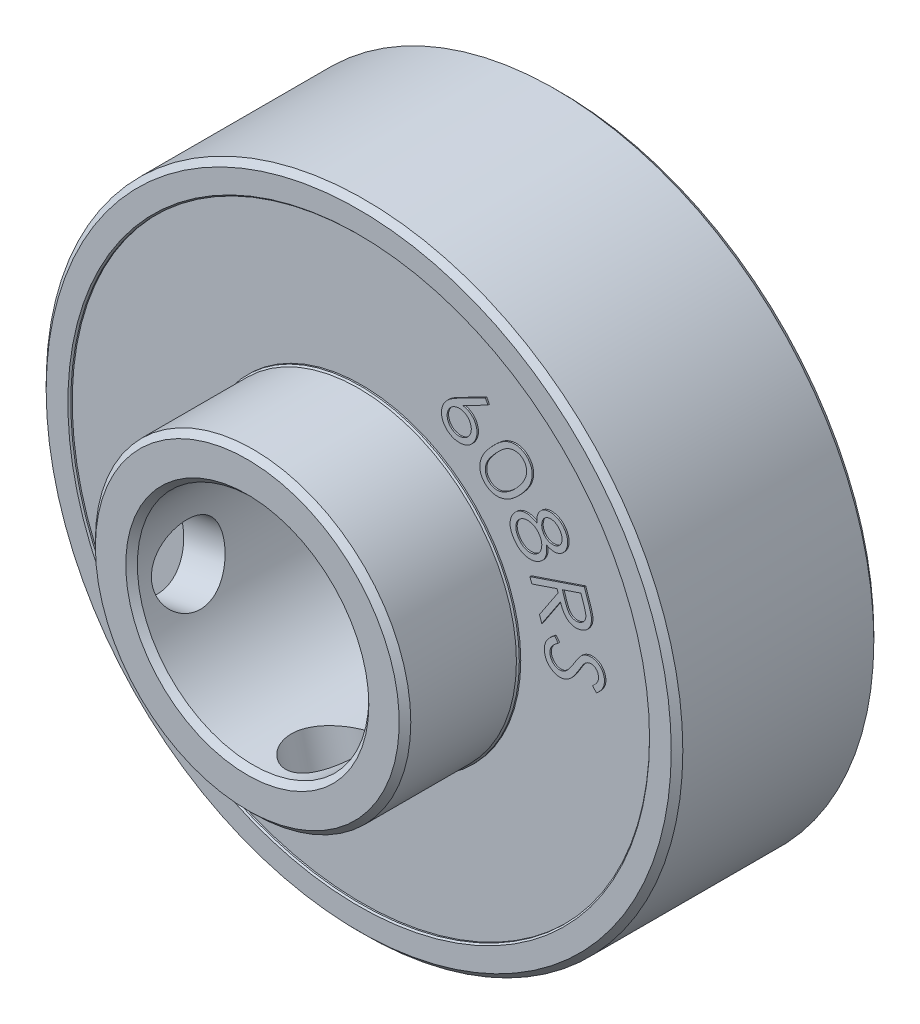
from build123d import *

# Parameters (mm, degrees)
SKETCH1_R                           = 11
SKETCH1_R_2                         = 4
BOSS_EXTRUDE1_DEPTH                 = 7
SKETCH2_R                           = 10
SKETCH2_R_2                         = 5.5
CUT_EXTRUDE1_DEPTH                  = 0.1
CUT_EXTRUDE2_START                  = -6.9
SKETCH2_2_R                         = 10
SKETCH2_2_R_2                       = 5.5
CUT_EXTRUDE2_DEPTH                  = 0.1
CHAMFER2_SIZE                       = 0.05
ESBO_O2_R                           = 5.45
ESBO_O2_R_2                         = 4
RESSALTO_EXTRUS_O1_DEPTH            = 3.85
BOSS_EXTRUDE2_DEPTH                 = 0.05
CHAMFER1_SIZE                       = 0.2
BOSS_EXTRUDE3_DEPTH                 = 0.05
FURO_ROSCADO_DE_M31_D               = 2.5
FURO_ROSCADO_DE_M31_DEPTH           = 7.5
FURO_ROSCADO_DE_M31_TIP             = 0.751075774
FURO_ROSCADO_DE_M31_ON_FACE_2_D     = 2.5
FURO_ROSCADO_DE_M31_ON_FACE_2_DEPTH = 7.5
FURO_ROSCADO_DE_M31_ON_FACE_2_TIP   = 0.751075774


with BuildPart() as part:
    # Sketch1 → Boss-Extrude1 (new body)
    with BuildSketch(Plane.XY):
        Circle(SKETCH1_R)
        Circle(SKETCH1_R_2, mode=Mode.SUBTRACT)
    extrude(amount=BOSS_EXTRUDE1_DEPTH)

    # Sketch2 → Cut-Extrude1 (cut)
    with BuildSketch(Plane.XY.offset(7)):
        Circle(SKETCH2_R)
        Circle(SKETCH2_R_2, mode=Mode.SUBTRACT)
    extrude(amount=-CUT_EXTRUDE1_DEPTH, mode=Mode.SUBTRACT)

    # Sketch2<2> → Cut-Extrude2 (cut)
    with BuildSketch(Plane.XY.offset(7).offset(CUT_EXTRUDE2_START)):
        Circle(SKETCH2_2_R)
        Circle(SKETCH2_2_R_2, mode=Mode.SUBTRACT)
    extrude(amount=-CUT_EXTRUDE2_DEPTH, mode=Mode.SUBTRACT)

    # Chamfer2
    chamfer2_edges = [part.edges().sort_by_distance(p)[0] for p in [
        (-5.5, 0, 7),
        (-10, 0, 7),
        (-10, 0, 0),
        (-5.5, 0, 0),
    ]]
    chamfer(chamfer2_edges, length=CHAMFER2_SIZE)

    # Esboço2 → Ressalto-extrusão1 (add)
    with BuildSketch(Plane.XY.offset(7)):
        Circle(ESBO_O2_R)
        Circle(ESBO_O2_R_2, mode=Mode.SUBTRACT)
    extrude(amount=RESSALTO_EXTRUS_O1_DEPTH)

    # Sketch3 → Boss-Extrude2 (add)
    # profile 1 of 5: a face of its own
    with BuildSketch(Plane(origin=(0, 0, 0.1), x_dir=(-1, 0, 0), z_dir=(0, 0, -1))):
        with BuildLine():
            Line((6.723953336, 1.374086402), (6.841741797, 1.216634479))
            add(Edge.make_bspline(
                [(6.841741797, 1.216634479), (6.817573288, 1.199359859), (6.771292818, 1.166280551), (6.7089583, 1.113159264), (6.65797847, 1.058354359), (6.616042027, 1.003718422), (6.585197602, 0.947642508), (6.564677897, 0.890789262), (6.554264641, 0.832905218), (6.556279326, 0.794387119), (6.557286669, 0.775128069)],
                knots=[0, 0, 0, 0, 1.292055059, 2.474166467, 3.555169481, 4.54276915, 5.463097752, 6.326728609, 7.163364304, 8, 8, 8, 8], degree=3))
            add(Edge.make_bspline(
                [(6.557286669, 0.775128069), (6.559589482, 0.75889953), (6.564156821, 0.726712276), (6.577499183, 0.679747808), (6.597073867, 0.635157474), (6.621192779, 0.592867963), (6.650084971, 0.554531373), (6.683420565, 0.521824686), (6.71962411, 0.494193194), (6.759139635, 0.472574946), (6.800541147, 0.456589651), (6.843001787, 0.446611622), (6.8860034, 0.441689172), (6.914655203, 0.443624683), (6.929081541, 0.444599223)],
                knots=[0, 0, 0, 0, 1.065647424, 2.113576877, 3.164384275, 4.227051853, 5.274981306, 6.276492859, 7.256630379, 8.228879028, 9.197081163, 10.13494145, 11.060932943, 12, 12, 12, 12], degree=3))
            add(Edge.make_bspline(
                [(6.929081541, 0.444599223), (6.945519436, 0.447087772), (6.978756008, 0.45211949), (7.026704444, 0.470689174), (7.073741901, 0.496394668), (7.101970562, 0.519552155), (7.116581541, 0.531538325)],
                knots=[0, 0, 0, 0, 0.947990027, 1.916786729, 2.921741833, 4, 4, 4, 4], degree=3))
            add(Edge.make_bspline(
                [(7.116581541, 0.531538325), (7.127135431, 0.541011836), (7.149222449, 0.560837855), (7.181222658, 0.595056366), (7.214764351, 0.633812728), (7.249572833, 0.677474782), (7.285307224, 0.726179014), (7.3219168, 0.780016687), (7.360652209, 0.838318589), (7.38569458, 0.879600754), (7.398632823, 0.900929351)],
                knots=[0, 0, 0, 0, 0.729441018, 1.526562937, 2.408317325, 3.366672661, 4.398852945, 5.515801495, 6.716528806, 8, 8, 8, 8], degree=3))
            add(Edge.make_bspline(
                [(7.398632823, 0.900929351), (7.411481182, 0.922096096), (7.436017587, 0.962518055), (7.472820572, 1.019379999), (7.50609449, 1.07074534), (7.537338687, 1.115557702), (7.565826722, 1.154147196), (7.591394823, 1.186795914), (7.614407064, 1.213420818), (7.629713327, 1.228338761), (7.636613592, 1.235063966)],
                knots=[0, 0, 0, 0, 1.445236574, 2.759956344, 3.953419532, 5.017350228, 5.948124348, 6.752849745, 7.43776821, 8, 8, 8, 8], degree=3))
            add(Edge.make_bspline(
                [(7.636613592, 1.235063966), (7.647453442, 1.244543907), (7.668850152, 1.263256302), (7.702463752, 1.288692966), (7.737555465, 1.310371795), (7.773613033, 1.328839241), (7.810780176, 1.344090457), (7.848714771, 1.356654507), (7.887907457, 1.365581106), (7.91448874, 1.368839266), (7.927879618, 1.370480633)],
                knots=[0, 0, 0, 0, 1.056756624, 2.085925105, 3.08957304, 4.080262677, 5.055903979, 6.035378084, 7.010280581, 8, 8, 8, 8], degree=3))
            add(Edge.make_bspline(
                [(7.927879618, 1.370480633), (7.948981269, 1.371870248), (7.990587385, 1.37461015), (8.052279005, 1.368496586), (8.111981804, 1.355515205), (8.168798048, 1.333504491), (8.222511066, 1.304967414), (8.271642008, 1.26880591), (8.315398275, 1.225611054), (8.35382237, 1.176261797), (8.385992991, 1.122092785), (8.41166226, 1.064244335), (8.429536588, 1.002885194), (8.435353033, 0.960458902), (8.438296284, 0.938990248)],
                knots=[0, 0, 0, 0, 1.01991207, 2.010960161, 2.982781706, 3.962746851, 4.943984954, 5.912890685, 6.898148972, 7.904611514, 8.925685622, 9.933656005, 10.954383679, 12, 12, 12, 12], degree=3))
            add(Edge.make_bspline(
                [(8.438296284, 0.938990248), (8.439905173, 0.916018968), (8.443100643, 0.870394895), (8.435954309, 0.802226976), (8.421251944, 0.735375989), (8.401131857, 0.681031699), (8.37977872, 0.638088379), (8.360564, 0.604548729), (8.337040201, 0.570775496), (8.310670734, 0.53558058), (8.279863744, 0.500254418), (8.246489716, 0.463106616), (8.208609747, 0.426121993), (8.181946924, 0.401530075), (8.168264233, 0.38891012)],
                knots=[0, 0, 0, 0, 1.294867467, 2.571782184, 3.843746611, 5.143215914, 5.822746795, 6.543964101, 7.318006915, 8.13942962, 9.019769218, 9.956863672, 10.951513765, 12, 12, 12, 12], degree=3))
            Line((8.168264233, 0.38891012), (8.029642438, 0.537547941))
            add(Edge.make_bspline(
                [(8.029642438, 0.537547941), (8.040491364, 0.547797716), (8.061430909, 0.567580842), (8.091198861, 0.596726402), (8.1177117, 0.624750316), (8.140998798, 0.651703899), (8.161430413, 0.677149832), (8.178807729, 0.701361339), (8.193307277, 0.724006553), (8.208313949, 0.752376209), (8.222111687, 0.78797107), (8.232490263, 0.831773931), (8.237254627, 0.876823898), (8.235338696, 0.906937777), (8.234370002, 0.922163325)],
                knots=[0, 0, 0, 0, 1.182699611, 2.282732375, 3.300866298, 4.238668036, 5.104698929, 5.88587987, 6.599324344, 7.233663973, 8.426546453, 9.612413994, 10.792838817, 12, 12, 12, 12], degree=3))
            add(Edge.make_bspline(
                [(8.234370002, 0.922163325), (8.231544844, 0.941132772), (8.226095153, 0.97772457), (8.207511221, 1.029103552), (8.179226125, 1.07342249), (8.143481188, 1.110786437), (8.101919482, 1.139998909), (8.056290048, 1.160326247), (8.006902954, 1.169811767), (7.973443836, 1.168186943), (7.956325131, 1.167355633)],
                knots=[0, 0, 0, 0, 1.109513479, 2.140235993, 3.138523126, 4.134648421, 5.117916045, 6.063936821, 7.00945106, 8, 8, 8, 8], degree=3))
            add(Edge.make_bspline(
                [(7.956325131, 1.167355633), (7.945745182, 1.165793238), (7.92452439, 1.162659454), (7.893216116, 1.154810012), (7.863019919, 1.142853978), (7.833191485, 1.128051735), (7.803915641, 1.108026169), (7.773495168, 1.083650001), (7.743435661, 1.052289809), (7.723571823, 1.029230065), (7.713136028, 1.017115248)],
                knots=[0, 0, 0, 0, 0.872627401, 1.750277355, 2.626708255, 3.518723759, 4.461878059, 5.515567722, 6.694762481, 8, 8, 8, 8], degree=3))
            add(Edge.make_bspline(
                [(7.713136028, 1.017115248), (7.709759885, 1.012601252), (7.701657657, 1.00176835), (7.688608104, 0.982001066), (7.672276268, 0.956433232), (7.65262288, 0.924978085), (7.629276842, 0.887948617), (7.60342511, 0.84439932), (7.573757222, 0.795347482), (7.552995234, 0.760582288), (7.54206231, 0.742275505)],
                knots=[0, 0, 0, 0, 0.417704147, 1.002426291, 1.754721007, 2.666443671, 3.751275867, 4.998903859, 6.419671761, 8, 8, 8, 8], degree=3))
            add(Edge.make_bspline(
                [(7.54206231, 0.742275505), (7.528720878, 0.72014766), (7.502869753, 0.677271475), (7.462909444, 0.616494005), (7.424908705, 0.560118495), (7.386533341, 0.509633022), (7.349495907, 0.463846731), (7.313037636, 0.423278472), (7.277439614, 0.387815365), (7.231706317, 0.348414155), (7.174122265, 0.307697522), (7.102778014, 0.269865497), (7.029575045, 0.243643782), (6.979473401, 0.23602383), (6.954722566, 0.232259479)],
                knots=[0, 0, 0, 0, 1.151589416, 2.231385892, 3.241866087, 4.181198595, 5.056967968, 5.86622306, 6.611257172, 7.295010099, 8.555133183, 9.745337415, 10.8861687, 12, 12, 12, 12], degree=3))
            add(Edge.make_bspline(
                [(6.954722566, 0.232259479), (6.937104145, 0.230954156), (6.902273291, 0.228373588), (6.850287945, 0.230996996), (6.799553841, 0.238604602), (6.7498888, 0.251362609), (6.70178582, 0.270191913), (6.654518449, 0.293243368), (6.609132064, 0.322693373), (6.565113537, 0.35621304), (6.524107945, 0.393956855), (6.487534332, 0.434933646), (6.45562657, 0.478557564), (6.428202178, 0.524760922), (6.405676349, 0.573922386), (6.388114701, 0.625763552), (6.37509852, 0.680239147), (6.370249322, 0.717645223), (6.367783464, 0.73666653)],
                knots=[0, 0, 0, 0, 0.985637329, 1.948562123, 2.898699275, 3.846375535, 4.804641011, 5.778360361, 6.777444169, 7.819911255, 8.864722404, 9.88397061, 10.881717925, 11.877903731, 12.878850076, 13.895148367, 14.929665032, 16, 16, 16, 16], degree=3))
            add(Edge.make_bspline(
                [(6.367783464, 0.73666653), (6.366427586, 0.751479961), (6.36374365, 0.780802889), (6.364781078, 0.824712107), (6.366958187, 0.867892434), (6.373888092, 0.910243045), (6.38267062, 0.952061727), (6.395985544, 0.99277455), (6.410879198, 1.033227048), (6.430041569, 1.072638466), (6.452506534, 1.111705681), (6.479103013, 1.150236727), (6.509821859, 1.188344837), (6.544257517, 1.226550474), (6.583270723, 1.264064543), (6.626226549, 1.301327262), (6.673295047, 1.338362343), (6.706747289, 1.361952754), (6.723953336, 1.374086402)],
                knots=[0, 0, 0, 0, 0.924783812, 1.830593555, 2.729938474, 3.612542721, 4.497647048, 5.385983185, 6.274940971, 7.178116819, 8.108855036, 9.07694148, 10.087910257, 11.152769032, 12.275211649, 13.45327497, 14.690100631, 16, 16, 16, 16], degree=3))
        make_face()
    # profile 2 of 5: a face of its own
    with BuildSketch(Plane(origin=(0, 0, 0.1), x_dir=(-1, 0, 0), z_dir=(0, 0, -1))):
        with BuildLine():
            Line((7.746137114, 3.357649879), (7.872739678, 2.983451161))
            add(Edge.make_bspline(
                [(7.872739678, 2.983451161), (7.881059185, 2.958357449), (7.896967784, 2.910373143), (7.919192418, 2.841249827), (7.93827157, 2.778162874), (7.954988951, 2.721116942), (7.968277975, 2.670083531), (7.97810167, 2.624967975), (7.986304921, 2.586220173), (7.989206196, 2.562134117), (7.99052814, 2.551159494)],
                knots=[0, 0, 0, 0, 1.41401025, 2.703876705, 3.883389485, 4.939117467, 5.883308228, 6.703003456, 7.409033675, 8, 8, 8, 8], degree=3))
            add(Edge.make_bspline(
                [(7.99052814, 2.551159494), (7.991680371, 2.536346044), (7.993961878, 2.507014281), (7.99355178, 2.463189389), (7.989536296, 2.420458725), (7.982244147, 2.378807362), (7.971867446, 2.338150413), (7.957859366, 2.298427821), (7.940049121, 2.259949253), (7.919392559, 2.222682043), (7.895267023, 2.187520322), (7.868522083, 2.15435442), (7.838146422, 2.124526727), (7.805654899, 2.096319063), (7.769505392, 2.071821996), (7.730676725, 2.049581161), (7.689074117, 2.029824145), (7.65969703, 2.019263938), (7.644774935, 2.013899879)],
                knots=[0, 0, 0, 0, 1.027353843, 2.034239082, 3.026914782, 3.992754084, 4.956116645, 5.926055136, 6.901519887, 7.885736109, 8.869562139, 9.847691085, 10.827432488, 11.810304063, 12.819812835, 13.841795782, 14.903739854, 16, 16, 16, 16], degree=3))
            add(Edge.make_bspline(
                [(7.644774935, 2.013899879), (7.619571721, 2.006225956), (7.570483848, 1.991279587), (7.495245456, 1.981482942), (7.421726968, 1.981550073), (7.350113043, 1.99285135), (7.28164526, 2.01459628), (7.217050526, 2.046407449), (7.157909987, 2.089546729), (7.111856988, 2.132170274), (7.078246075, 2.172604827), (7.052872874, 2.206693439), (7.028502864, 2.24470871), (7.00542963, 2.286885007), (6.981948203, 2.332291093), (6.960215509, 2.382102891), (6.938952909, 2.435460163), (6.925647847, 2.472458787), (6.918813396, 2.491463981)],
                knots=[0, 0, 0, 0, 1.278263464, 2.489652168, 3.670679834, 4.839936614, 5.997393751, 7.149490657, 8.321732671, 9.542815408, 10.187555536, 10.874109659, 11.606713321, 12.379429923, 13.209421677, 14.089665205, 15.018712606, 16, 16, 16, 16], degree=3))
            Line((6.918813396, 2.491463981), (6.274181986, 1.519909494))
            Line((6.274181986, 1.519909494), (6.195656345, 1.75268193))
            Line((6.195656345, 1.75268193), (6.840688396, 2.722633853))
            Line((6.840688396, 2.722633853), (6.804630704, 2.829605007))
            Line((6.804630704, 2.829605007), (5.931233268, 2.53393193))
            Line((5.931233268, 2.53393193), (5.867531345, 2.721832571))
            Line((5.867531345, 2.721832571), (7.746137114, 3.357649879))
        make_face()
        with BuildLine():
            Line((7.625944806, 3.107649879), (6.987323011, 2.891303725))
            Line((6.987323011, 2.891303725), (7.093893524, 2.567585776))
            add(Edge.make_bspline(
                [(7.093893524, 2.567585776), (7.099141602, 2.552460366), (7.109268083, 2.523274973), (7.12546665, 2.481526975), (7.141165795, 2.442969417), (7.157905934, 2.408224542), (7.173577508, 2.37635315), (7.19005439, 2.34833638), (7.206517147, 2.323717963), (7.228098548, 2.295648952), (7.257158343, 2.265709238), (7.296463649, 2.236869944), (7.338965987, 2.214103265), (7.38510297, 2.199047445), (7.432884658, 2.190547052), (7.481570808, 2.189590563), (7.530612026, 2.194710922), (7.562229046, 2.204464605), (7.578268524, 2.209412699)],
                knots=[0, 0, 0, 0, 1.118554581, 2.158318542, 3.128777667, 4.026236993, 4.852521549, 5.609511046, 6.2953485, 6.920617761, 8.081985124, 9.196171859, 10.314843201, 11.436157874, 12.572935431, 13.69304583, 14.829670183, 16, 16, 16, 16], degree=3))
            add(Edge.make_bspline(
                [(7.578268524, 2.209412699), (7.59342902, 2.215251964), (7.62342383, 2.226804859), (7.664579795, 2.251684726), (7.701464878, 2.282014563), (7.733367565, 2.317620085), (7.759719917, 2.357194019), (7.780045409, 2.399320856), (7.793065142, 2.44385535), (7.798012121, 2.482767203), (7.798617957, 2.516069958), (7.796430694, 2.544330853), (7.791830588, 2.575579595), (7.785411015, 2.609926292), (7.776957572, 2.647370858), (7.766058218, 2.687842945), (7.752740917, 2.731460489), (7.742856393, 2.761514748), (7.737723652, 2.777121033)],
                knots=[0, 0, 0, 0, 1.157480747, 2.290057996, 3.413820966, 4.554229024, 5.688088466, 6.796349954, 7.878911532, 8.984095935, 9.584534887, 10.253304793, 11.003966908, 11.837573395, 12.74613744, 13.742422656, 14.827707137, 16, 16, 16, 16], degree=3))
            Line((7.737723652, 2.777121033), (7.625944806, 3.107649879))
        make_face(mode=Mode.SUBTRACT)
    # profile 3 of 5: a face of its own
    with BuildSketch(Plane(origin=(0, 0, 0.1), x_dir=(-1, 0, 0), z_dir=(0, 0, -1))):
        with BuildLine():
            add(Edge.make_bspline(
                [(6.436645373, 3.958851709), (6.438849744, 3.940573746), (6.443153326, 3.904889774), (6.446080097, 3.852458084), (6.447345332, 3.802571834), (6.444615596, 3.755237655), (6.440242818, 3.710182835), (6.431945321, 3.667690701), (6.421801836, 3.627540907), (6.408467872, 3.589869698), (6.392118978, 3.554645749), (6.374421381, 3.520656156), (6.353059749, 3.489126668), (6.330588283, 3.458332588), (6.304473045, 3.429986163), (6.276658623, 3.402650225), (6.246016539, 3.377299569), (6.224148017, 3.36201487), (6.213087681, 3.354284402)],
                knots=[0, 0, 0, 0, 1.290890309, 2.520198396, 3.681805585, 4.788490099, 5.843551436, 6.853927339, 7.821726867, 8.74603337, 9.651448064, 10.544029729, 11.429902383, 12.319727641, 13.215057227, 14.129151139, 15.053789794, 16, 16, 16, 16], degree=3))
            add(Edge.make_bspline(
                [(6.213087681, 3.354284402), (6.197080539, 3.344144505), (6.165376402, 3.324061175), (6.115609733, 3.298721518), (6.064443052, 3.278646051), (6.012154311, 3.263322512), (5.958510855, 3.252871046), (5.903673026, 3.247212262), (5.847609117, 3.246868388), (5.810160039, 3.250090216), (5.791212681, 3.251720299)],
                knots=[0, 0, 0, 0, 1.02459754, 2.029343036, 3.015319328, 3.993724459, 4.972689464, 5.967517749, 6.971665777, 8, 8, 8, 8], degree=3))
            add(Edge.make_bspline(
                [(5.791212681, 3.251720299), (5.76812279, 3.255152686), (5.722105673, 3.26199328), (5.655371216, 3.282467937), (5.591465368, 3.310695655), (5.530691013, 3.347287029), (5.472409223, 3.391028314), (5.417139616, 3.44291569), (5.364964002, 3.502778785), (5.333693598, 3.547097948), (5.317654988, 3.569829274)],
                knots=[0, 0, 0, 0, 0.94927729, 1.891867025, 2.831441269, 3.787189233, 4.773456595, 5.792841766, 6.867947176, 8, 8, 8, 8], degree=3))
            add(Edge.make_bspline(
                [(5.317654988, 3.569829274), (5.303063571, 3.592276258), (5.274661246, 3.635969511), (5.240442419, 3.70396576), (5.213126694, 3.770723532), (5.193673612, 3.836759996), (5.18189304, 3.902041339), (5.177652501, 3.9664582), (5.181746591, 4.030123994), (5.193666901, 4.092147537), (5.210811163, 4.152011519), (5.232533781, 4.208453206), (5.257704373, 4.261497857), (5.287473484, 4.310315858), (5.320899663, 4.355598373), (5.358263051, 4.396995678), (5.399718813, 4.434649249), (5.43013903, 4.456340746), (5.445459476, 4.467265171)],
                knots=[0, 0, 0, 0, 1.265189782, 2.462703114, 3.593198436, 4.67234407, 5.711673085, 6.724080211, 7.71757927, 8.719632106, 9.70506986, 10.658584755, 11.576575664, 12.477685061, 13.358041525, 14.234425087, 15.110808649, 16, 16, 16, 16], degree=3))
            add(Edge.make_bspline(
                [(5.445459476, 4.467265171), (5.456987966, 4.474624406), (5.480000329, 4.489314395), (5.515649837, 4.508441139), (5.552366299, 4.524126629), (5.589327481, 4.537519912), (5.627481553, 4.547343512), (5.665928122, 4.555312832), (5.705401353, 4.558925918), (5.745399858, 4.560814177), (5.786673455, 4.559096182), (5.829078302, 4.554049573), (5.872697014, 4.544281293), (5.91778122, 4.532182679), (5.964098431, 4.515785424), (6.011833619, 4.496274612), (6.060588671, 4.472457347), (6.093098017, 4.454707355), (6.109722296, 4.445630556)],
                knots=[0, 0, 0, 0, 0.931334836, 1.859065266, 2.751202648, 3.648748233, 4.533436264, 5.43245535, 6.319384756, 7.229651734, 8.158095254, 9.129430785, 10.133761898, 11.19951572, 12.306952597, 13.477470392, 14.710056011, 16, 16, 16, 16], degree=3))
            add(Edge.make_bspline(
                [(6.109722296, 4.445630556), (6.107482301, 4.47205299), (6.10313889, 4.52328682), (6.107287375, 4.598282233), (6.11985051, 4.668288878), (6.14164351, 4.732865757), (6.171434346, 4.791786736), (6.208476731, 4.844446438), (6.252045054, 4.891203726), (6.28610488, 4.91622277), (6.303231911, 4.928803633)],
                knots=[0, 0, 0, 0, 1.159116483, 2.247558892, 3.275615725, 4.262372356, 5.218835671, 6.154236364, 7.07185513, 8, 8, 8, 8], degree=3))
            add(Edge.make_bspline(
                [(6.303231911, 4.928803633), (6.321754889, 4.940084937), (6.359014229, 4.962777505), (6.421256217, 4.986222737), (6.488036273, 5.000993457), (6.558445944, 5.007117844), (6.630670913, 5.005090507), (6.702669609, 4.992413163), (6.77329377, 4.969774079), (6.841463499, 4.937151075), (6.906181416, 4.896456921), (6.965941656, 4.848096386), (7.019799943, 4.792057066), (7.050247347, 4.749841495), (7.065651783, 4.72848312)],
                knots=[0, 0, 0, 0, 0.892779067, 1.795842916, 2.727080536, 3.70581188, 4.703144711, 5.698163754, 6.710047702, 7.752069251, 8.806330382, 9.855631886, 10.91508709, 12, 12, 12, 12], degree=3))
            add(Edge.make_bspline(
                [(7.065651783, 4.72848312), (7.079336383, 4.706774175), (7.106401224, 4.663839111), (7.136261198, 4.594226894), (7.157475004, 4.522286133), (7.168858659, 4.44845505), (7.171401759, 4.374581199), (7.164611604, 4.302250625), (7.148558493, 4.232231558), (7.122885922, 4.165630452), (7.089294662, 4.103906053), (7.0495902, 4.047721731), (7.002341174, 3.999113654), (6.966283703, 3.972535032), (6.948263963, 3.95925235)],
                knots=[0, 0, 0, 0, 1.068771019, 2.113771646, 3.146516798, 4.18939315, 5.220229497, 6.221594843, 7.210477599, 8.206485729, 9.188317762, 10.134173663, 11.067552274, 12, 12, 12, 12], degree=3))
            add(Edge.make_bspline(
                [(6.948263963, 3.95925235), (6.92948131, 3.947579211), (6.892704816, 3.924723167), (6.832726752, 3.900840341), (6.770949722, 3.886814804), (6.707208907, 3.88185386), (6.641795956, 3.887028294), (6.57452711, 3.90142974), (6.505301459, 3.925243395), (6.460060234, 3.947389739), (6.436645373, 3.958851709)],
                knots=[0, 0, 0, 0, 0.981875121, 1.922514633, 2.854567088, 3.789622669, 4.754286786, 5.76174218, 6.841576559, 8, 8, 8, 8], degree=3))
        make_face()
        with BuildLine():
            add(Edge.make_bspline(
                [(6.899786399, 4.627521581), (6.89206632, 4.638457323), (6.87685916, 4.659998761), (6.851731015, 4.689696603), (6.824543522, 4.715861262), (6.79632334, 4.739189166), (6.766173857, 4.759065259), (6.734647119, 4.775820377), (6.701543011, 4.789622008), (6.667263629, 4.799834203), (6.632827413, 4.807110393), (6.598864764, 4.810677554), (6.565845271, 4.811257308), (6.533573133, 4.808043896), (6.502305027, 4.801150813), (6.471895114, 4.791090338), (6.442508709, 4.777396374), (6.423983999, 4.765933971), (6.414610117, 4.760133761)],
                knots=[0, 0, 0, 0, 1.147797877, 2.260954539, 3.330167184, 4.38025149, 5.396817843, 6.421610434, 7.438370352, 8.467442645, 9.485040915, 10.452679454, 11.391973248, 12.312859485, 13.227240642, 14.132754951, 15.055135845, 16, 16, 16, 16], degree=3))
            add(Edge.make_bspline(
                [(6.414610117, 4.760133761), (6.405774199, 4.753786345), (6.388108367, 4.741095827), (6.364373565, 4.718498267), (6.343734102, 4.693036444), (6.324762197, 4.66560438), (6.309508042, 4.635122756), (6.296405059, 4.602338894), (6.286620035, 4.566820361), (6.27902636, 4.529487679), (6.274755334, 4.491152689), (6.273205383, 4.453199531), (6.276275975, 4.416049243), (6.282273469, 4.379861769), (6.29134367, 4.344469632), (6.304515391, 4.310097751), (6.320673305, 4.276359421), (6.334378057, 4.255189882), (6.341292809, 4.244508761)],
                knots=[0, 0, 0, 0, 0.908844192, 1.81707094, 2.729132775, 3.645761934, 4.599514883, 5.571907187, 6.593318126, 7.675011067, 8.753876802, 9.815092739, 10.84525358, 11.863975947, 12.879511735, 13.893573417, 14.937199413, 16, 16, 16, 16], degree=3))
            add(Edge.make_bspline(
                [(6.341292809, 4.244508761), (6.350814274, 4.231255034), (6.369827412, 4.204789049), (6.404691636, 4.170598056), (6.443344082, 4.140394154), (6.485652106, 4.115036742), (6.53091205, 4.095367527), (6.577788532, 4.082025189), (6.625777609, 4.074990316), (6.673984131, 4.075405122), (6.721007008, 4.080627131), (6.765184168, 4.092077638), (6.806448491, 4.107815252), (6.831074035, 4.122859441), (6.843296014, 4.130326068)],
                knots=[0, 0, 0, 0, 1.029778083, 2.056334151, 3.072742447, 4.125103068, 5.164692881, 6.18264204, 7.197261409, 8.21856438, 9.221531217, 10.179595353, 11.096509409, 12, 12, 12, 12], degree=3))
            add(Edge.make_bspline(
                [(6.843296014, 4.130326068), (6.851446438, 4.13616324), (6.867594435, 4.147728114), (6.88939698, 4.168131937), (6.90904658, 4.190508833), (6.92640353, 4.215277105), (6.941639015, 4.242075679), (6.954455745, 4.271261696), (6.965288178, 4.302452796), (6.973600755, 4.335686204), (6.979511889, 4.370209731), (6.980683648, 4.405777115), (6.977172407, 4.441591107), (6.970465098, 4.478043747), (6.9591051, 4.514969221), (6.943248573, 4.552252268), (6.923519635, 4.590151684), (6.907856867, 4.614813977), (6.899786399, 4.627521581)],
                knots=[0, 0, 0, 0, 0.860567069, 1.704995385, 2.558804371, 3.415153889, 4.298967395, 5.203031682, 6.150124742, 7.132495547, 8.143595732, 9.153914339, 10.17923786, 11.230179396, 12.333615959, 13.490750709, 14.707072956, 16, 16, 16, 16], degree=3))
        make_face(mode=Mode.SUBTRACT)
        with BuildLine():
            add(Edge.make_bspline(
                [(6.192654988, 4.141544017), (6.183073031, 4.155401294), (6.164227572, 4.182655302), (6.131187317, 4.218933327), (6.097015473, 4.252070626), (6.059989677, 4.280785033), (6.020837675, 4.305788703), (5.978908288, 4.326108106), (5.934953683, 4.342757084), (5.889255118, 4.354794419), (5.843074833, 4.363522847), (5.797427161, 4.366805064), (5.753115121, 4.366894985), (5.710232395, 4.361231726), (5.668413788, 4.352462102), (5.628232574, 4.337906769), (5.58882321, 4.320171181), (5.564407056, 4.304523989), (5.552029988, 4.296592094)],
                knots=[0, 0, 0, 0, 1.103096915, 2.169532516, 3.209705979, 4.22005898, 5.235178716, 6.249127762, 7.268541052, 8.31114268, 9.343069619, 10.344088993, 11.307028603, 12.241865975, 13.174241085, 14.101672058, 15.037697202, 16, 16, 16, 16], degree=3))
            add(Edge.make_bspline(
                [(5.552029988, 4.296592094), (5.53739373, 4.285920167), (5.508158373, 4.264603408), (5.470459325, 4.225147952), (5.438160928, 4.180583136), (5.411429753, 4.131524815), (5.391128257, 4.078821031), (5.379712135, 4.02334043), (5.375573245, 3.966204794), (5.379709706, 3.907692931), (5.391978104, 3.848519155), (5.411845955, 3.789219006), (5.439605058, 3.729865997), (5.463581076, 3.692173419), (5.475908194, 3.672794017)],
                knots=[0, 0, 0, 0, 0.926109246, 1.849867156, 2.780058085, 3.737943589, 4.703270699, 5.660960876, 6.627667837, 7.628486545, 8.654526651, 9.714225142, 10.824783286, 12, 12, 12, 12], degree=3))
            add(Edge.make_bspline(
                [(5.475908194, 3.672794017), (5.486060461, 3.658170197), (5.505883669, 3.629615884), (5.539352829, 3.591150094), (5.574498341, 3.557119283), (5.611193238, 3.52754691), (5.649610266, 3.502113814), (5.690285635, 3.482258235), (5.73254201, 3.466467844), (5.776087466, 3.455386323), (5.819965834, 3.44854851), (5.863310687, 3.446190652), (5.905570882, 3.447721693), (5.946649447, 3.453327605), (5.986515083, 3.463003588), (6.025261611, 3.476638949), (6.062787941, 3.494832298), (6.086485292, 3.509769369), (6.098504347, 3.517345299)],
                knots=[0, 0, 0, 0, 1.19035752, 2.32427924, 3.40484362, 4.459799014, 5.473418872, 6.48040078, 7.481219341, 8.486773131, 9.481309882, 10.447796045, 11.386669185, 12.306601008, 13.216804754, 14.126789189, 15.049926509, 16, 16, 16, 16], degree=3))
            add(Edge.make_bspline(
                [(6.098504347, 3.517345299), (6.109623379, 3.525413647), (6.131612455, 3.541369668), (6.161538623, 3.568937135), (6.18821179, 3.599437638), (6.210866349, 3.633334346), (6.230793072, 3.669716469), (6.247216973, 3.709047676), (6.259874558, 3.751393122), (6.269542145, 3.795841921), (6.274911413, 3.841443699), (6.276921551, 3.886781556), (6.273360853, 3.931306877), (6.266335015, 3.975088203), (6.254596548, 4.018173699), (6.238424813, 4.06039773), (6.21802423, 4.101939076), (6.201197342, 4.128208206), (6.192654988, 4.141544017)],
                knots=[0, 0, 0, 0, 0.942671861, 1.864234432, 2.78725575, 3.718123832, 4.657802721, 5.631928245, 6.638488188, 7.688830978, 8.751153965, 9.788000563, 10.799352584, 11.812407604, 12.828984143, 13.859322421, 14.913261601, 16, 16, 16, 16], degree=3))
        make_face(mode=Mode.SUBTRACT)
    # profile 4 of 5: a face of its own
    with BuildSketch(Plane(origin=(0, 0, 0.1), x_dir=(-1, 0, 0), z_dir=(0, 0, -1))):
        with BuildLine():
            add(Edge.make_bspline(
                [(4.543033426, 5.949335529), (4.564943157, 5.972693181), (4.607527355, 6.018091587), (4.67157506, 6.0821776), (4.733665606, 6.140505217), (4.794137626, 6.192741517), (4.85293655, 6.238729797), (4.909649751, 6.279135227), (4.964441144, 6.313866459), (5.018164906, 6.342452083), (5.070566701, 6.366205448), (5.122024451, 6.38603643), (5.172895525, 6.401712181), (5.223134838, 6.413290127), (5.272621026, 6.421532789), (5.321665929, 6.425568094), (5.370160168, 6.42549656), (5.417968316, 6.42189385), (5.464631842, 6.414853045), (5.509827437, 6.403785557), (5.553710443, 6.389848585), (5.596047144, 6.372253298), (5.636808987, 6.351171515), (5.676066811, 6.327121226), (5.714074787, 6.299926787), (5.737519741, 6.279144916), (5.749363554, 6.268646427)],
                knots=[0, 0, 0, 0, 1.642537938, 3.192470103, 4.646338539, 6.011168142, 7.289605298, 8.473669563, 9.581665276, 10.614373007, 11.59226402, 12.531086133, 13.441104306, 14.320069679, 15.173659948, 16.012137794, 16.84096325, 17.65841702, 18.469272155, 19.258427056, 20.042601694, 20.82874835, 21.606886513, 22.39398752, 23.188682081, 24, 24, 24, 24], degree=3))
            add(Edge.make_bspline(
                [(5.749363554, 6.268646427), (5.760911716, 6.257617316), (5.783832443, 6.2357268), (5.814606127, 6.199685182), (5.842763625, 6.162273296), (5.86720813, 6.122744115), (5.888632845, 6.081687155), (5.906688759, 6.038659944), (5.921436917, 5.993756214), (5.933125957, 5.947322605), (5.941123235, 5.899359884), (5.945576238, 5.850210478), (5.945937318, 5.799696325), (5.942178582, 5.748167993), (5.934948076, 5.695283356), (5.923723996, 5.64133292), (5.908257359, 5.586132596), (5.889035669, 5.529625786), (5.865374627, 5.471491833), (5.83582998, 5.412255968), (5.80126516, 5.351314775), (5.761491532, 5.288687708), (5.716170301, 5.224741752), (5.665349958, 5.159251463), (5.609380215, 5.092013278), (5.569231642, 5.047489171), (5.5486424, 5.024656042)],
                knots=[0, 0, 0, 0, 0.812736739, 1.613115341, 2.410193159, 3.195255584, 3.977011722, 4.766451224, 5.568648116, 6.381840011, 7.202505524, 8.042362829, 8.892510741, 9.771967907, 10.671265438, 11.608935862, 12.575845681, 13.588824347, 14.647177854, 15.769502049, 16.957239641, 18.213799721, 19.545973321, 20.947120805, 22.434403522, 24, 24, 24, 24], degree=3))
            add(Edge.make_bspline(
                [(5.5486424, 5.024656042), (5.527680493, 5.002353903), (5.486797486, 4.958856979), (5.424765374, 4.897538301), (5.363751907, 4.841756827), (5.304193874, 4.791136914), (5.245683972, 4.746127832), (5.188196251, 4.706632475), (5.131917607, 4.672564327), (5.076622511, 4.643827313), (5.022302089, 4.620150633), (4.968866404, 4.60056073), (4.916443523, 4.584153257), (4.864386266, 4.572744454), (4.813189003, 4.564345172), (4.762509713, 4.561020629), (4.712689965, 4.560768112), (4.663807528, 4.564917701), (4.616099552, 4.572413487), (4.569931105, 4.58374163), (4.525340014, 4.598193132), (4.482211508, 4.615751886), (4.440882307, 4.637302377), (4.400706003, 4.661523567), (4.362510463, 4.689746565), (4.338690087, 4.710774866), (4.326687272, 4.721370786)],
                knots=[0, 0, 0, 0, 1.559433233, 3.041436978, 4.443008781, 5.770818333, 7.022943957, 8.202580838, 9.32288808, 10.372875569, 11.375398524, 12.339881119, 13.271916542, 14.171621232, 15.053181812, 15.912749435, 16.756523382, 17.589472185, 18.409479342, 19.214872608, 20.008917662, 20.796169375, 21.584390954, 22.381462505, 23.184437513, 24, 24, 24, 24], degree=3))
            add(Edge.make_bspline(
                [(4.326687272, 4.721370786), (4.315260387, 4.732257291), (4.292582092, 4.753863126), (4.262524999, 4.789474989), (4.234216651, 4.825811541), (4.210591491, 4.864827354), (4.189388006, 4.905106752), (4.171852571, 4.947252998), (4.157409917, 4.991049596), (4.146081336, 5.036416821), (4.1385724, 5.083328133), (4.134475716, 5.131406743), (4.134526669, 5.180589449), (4.138668218, 5.230653261), (4.146378676, 5.281762522), (4.157589801, 5.333992266), (4.172890384, 5.387243797), (4.192316993, 5.44187928), (4.216511887, 5.49808747), (4.245828348, 5.556425299), (4.281385112, 5.616628969), (4.322888369, 5.67887757), (4.369244831, 5.744006213), (4.421956893, 5.810719564), (4.480129534, 5.879757147), (4.521656172, 5.925690016), (4.543033426, 5.949335529)],
                knots=[0, 0, 0, 0, 0.809667474, 1.606901415, 2.389915423, 3.171938179, 3.944739181, 4.725317868, 5.512374, 6.310580304, 7.123290289, 7.948912628, 8.785395908, 9.645186643, 10.525642855, 11.437417869, 12.385812245, 13.368196359, 14.41253519, 15.525600646, 16.717987141, 17.999697683, 19.365829755, 20.821103961, 22.363554732, 24, 24, 24, 24], degree=3))
        make_face()
        with BuildLine():
            add(Edge.make_bspline(
                [(4.679251375, 5.818325914), (4.660851677, 5.798119355), (4.625169821, 5.75893352), (4.575066406, 5.700527005), (4.530060028, 5.644381866), (4.490109119, 5.590608243), (4.454150268, 5.539934716), (4.423546398, 5.49144367), (4.398220443, 5.445165553), (4.377241144, 5.40129025), (4.35988931, 5.359114478), (4.347091963, 5.31763911), (4.335718979, 5.277328241), (4.328855361, 5.237439496), (4.323935339, 5.198395489), (4.323658489, 5.159929724), (4.324705927, 5.122099941), (4.332062828, 5.073644615), (4.346039936, 5.016229297), (4.372941953, 4.953168665), (4.40806014, 4.896592751), (4.438775126, 4.865487268), (4.454091118, 4.849976555)],
                knots=[0, 0, 0, 0, 1.475488141, 2.861359785, 4.154121984, 5.359730204, 6.477947551, 7.508249804, 8.453740252, 9.324547233, 10.133287385, 10.913161477, 11.667000762, 12.392548848, 13.096455606, 13.788819075, 14.467224618, 15.137185669, 16.431314552, 17.646052312, 18.826206712, 20, 20, 20, 20], degree=3))
            add(Edge.make_bspline(
                [(4.454091118, 4.849976555), (4.470998304, 4.835844543), (4.504676122, 4.807694658), (4.563731671, 4.776736661), (4.628146618, 4.755513764), (4.685580759, 4.74573126), (4.73346006, 4.743796713), (4.770607522, 4.744784191), (4.808256766, 4.749765726), (4.846476655, 4.7579731), (4.885356808, 4.768707571), (4.924789742, 4.782747964), (4.964461886, 4.800624278), (4.990744591, 4.814196805), (5.004171247, 4.821130401)],
                knots=[0, 0, 0, 0, 1.34190696, 2.672975875, 4.03914862, 5.469008549, 6.211498008, 6.961821166, 7.734266787, 8.525620103, 9.346360653, 10.194610762, 11.077707539, 12, 12, 12, 12], degree=3))
            add(Edge.make_bspline(
                [(5.004171247, 4.821130401), (5.020977638, 4.830421862), (5.055134219, 4.849305423), (5.105185594, 4.881764095), (5.155673749, 4.917150584), (5.205669506, 4.95682755), (5.256454512, 4.999267098), (5.306984725, 5.045647846), (5.35784608, 5.095550455), (5.390788359, 5.130831575), (5.407616759, 5.14885476)],
                knots=[0, 0, 0, 0, 0.882398032, 1.79334748, 2.740232888, 3.715191852, 4.725879822, 5.7816566, 6.866770249, 8, 8, 8, 8], degree=3))
            add(Edge.make_bspline(
                [(5.407616759, 5.14885476), (5.424180747, 5.167029522), (5.45658333, 5.202583114), (5.501733152, 5.256702416), (5.543098053, 5.309660342), (5.58077131, 5.361374876), (5.615025998, 5.411615164), (5.644765307, 5.461224488), (5.670823679, 5.509629921), (5.693361068, 5.556938809), (5.712272001, 5.603065203), (5.727612485, 5.647874505), (5.739126559, 5.691583045), (5.748400632, 5.733736142), (5.752834323, 5.774825331), (5.755220583, 5.814429798), (5.753676352, 5.852830865), (5.746508693, 5.901432573), (5.732173642, 5.958555869), (5.706135375, 6.021663456), (5.67073215, 6.07767327), (5.640308497, 6.108613984), (5.625164836, 6.124015016)],
                knots=[0, 0, 0, 0, 1.327465575, 2.596797036, 3.803974219, 4.954802096, 6.050653377, 7.085610932, 8.075932289, 9.017660852, 9.913387465, 10.766122373, 11.572387875, 12.35293663, 13.093430198, 13.800930815, 14.493692928, 15.163603914, 16.450647312, 17.662487793, 18.836481221, 20, 20, 20, 20], degree=3))
            add(Edge.make_bspline(
                [(5.625164836, 6.124015016), (5.608285103, 6.138200877), (5.574619324, 6.166493862), (5.514977812, 6.196712457), (5.450201973, 6.218295255), (5.392180613, 6.227466046), (5.343795213, 6.230492325), (5.306274605, 6.228545799), (5.268394949, 6.224194501), (5.229871713, 6.21704111), (5.190985821, 6.205984316), (5.151532352, 6.192011613), (5.111544201, 6.174986568), (5.070779705, 6.154839157), (5.028631981, 6.130550497), (4.984923072, 6.100987844), (4.939041603, 6.06649501), (4.89071745, 6.027165691), (4.840939904, 5.982142624), (4.788729648, 5.932288445), (4.734224356, 5.877502417), (4.697964293, 5.838469719), (4.679251375, 5.818325914)],
                knots=[0, 0, 0, 0, 1.186933895, 2.367280006, 3.582519422, 4.861472594, 5.525769364, 6.196917143, 6.886441279, 7.583575583, 8.309531112, 9.066613021, 9.841978912, 10.654534034, 11.520211795, 12.46606624, 13.501419929, 14.618477826, 15.828573167, 17.123883194, 18.515707565, 20, 20, 20, 20], degree=3))
        make_face(mode=Mode.SUBTRACT)
    # profile 5 of 5: a face of its own
    with BuildSketch(Plane(origin=(0, 0, 0.1), x_dir=(-1, 0, 0), z_dir=(0, 0, -1))):
        with BuildLine():
            Line((4.324964443, 7.302356675), (4.416310597, 7.130481675))
            Line((4.416310597, 7.130481675), (3.555733674, 6.680962444))
            add(Edge.make_bspline(
                [(3.555733674, 6.680962444), (3.573820412, 6.677343593), (3.609234202, 6.670257891), (3.660020503, 6.655631802), (3.706959766, 6.637037992), (3.736127944, 6.622159713), (3.750445212, 6.614856675)],
                knots=[0, 0, 0, 0, 1.071524611, 2.098042594, 3.06641979, 4, 4, 4, 4], degree=3))
            add(Edge.make_bspline(
                [(3.750445212, 6.614856675), (3.767080526, 6.605028081), (3.79973166, 6.585736909), (3.844667082, 6.551553291), (3.885064799, 6.513987171), (3.921262857, 6.472864589), (3.951945795, 6.427668961), (3.978773631, 6.379220739), (4.000582274, 6.327012973), (4.018191547, 6.272085969), (4.030461657, 6.21560422), (4.037588265, 6.158731496), (4.038082899, 6.102220894), (4.033932701, 6.045949965), (4.023286554, 5.990142073), (4.007124801, 5.934646585), (3.985547474, 5.879431036), (3.966999274, 5.843995875), (3.957576622, 5.825994495)],
                knots=[0, 0, 0, 0, 1.019907112, 2.001833211, 2.975106465, 3.930005657, 4.888753167, 5.854816606, 6.850530802, 7.872265815, 8.897525529, 9.899342728, 10.89405696, 11.877628612, 12.875140218, 13.888660536, 14.927420607, 16, 16, 16, 16], degree=3))
            add(Edge.make_bspline(
                [(3.957576622, 5.825994495), (3.943401003, 5.802045015), (3.915487215, 5.75488512), (3.862951089, 5.692675141), (3.804519394, 5.638220775), (3.739385216, 5.593013878), (3.669307026, 5.556735668), (3.594664605, 5.530879797), (3.516222355, 5.515258034), (3.435036911, 5.509786674), (3.353146288, 5.514458347), (3.272777466, 5.529881756), (3.194647085, 5.555414913), (3.145724036, 5.580276576), (3.121038161, 5.592821418)],
                knots=[0, 0, 0, 0, 1.033065496, 2.034251297, 3.014475546, 3.995102051, 4.972102283, 5.939302282, 6.921736905, 7.936931798, 8.956451458, 9.962291878, 10.971801474, 12, 12, 12, 12], degree=3))
            add(Edge.make_bspline(
                [(3.121038161, 5.592821418), (3.098026879, 5.606472481), (3.0524791, 5.633492949), (2.992288878, 5.684987892), (2.938815288, 5.742646167), (2.893091356, 5.807005676), (2.856848611, 5.877071666), (2.829822579, 5.95090171), (2.814390825, 6.028443749), (2.808805845, 6.108143214), (2.813547075, 6.188295134), (2.828636553, 6.266552303), (2.852811134, 6.342529378), (2.87690699, 6.389852952), (2.889067007, 6.41373488)],
                knots=[0, 0, 0, 0, 1.012372306, 2.003856587, 2.988821669, 3.987270143, 4.9855775, 5.970178416, 6.956819527, 7.971542281, 8.990660658, 9.990237353, 10.98576963, 12, 12, 12, 12], degree=3))
            add(Edge.make_bspline(
                [(2.889067007, 6.41373488), (2.899540358, 6.431325076), (2.920940833, 6.467267588), (2.960198132, 6.517770314), (3.004943495, 6.567060495), (3.056853524, 6.615148364), (3.117971201, 6.662922917), (3.190061184, 6.711153599), (3.273543427, 6.760845263), (3.334013557, 6.792508176), (3.365829827, 6.809167572)],
                knots=[0, 0, 0, 0, 0.780869162, 1.595570546, 2.436441551, 3.320231236, 4.29319985, 5.394687772, 6.629218754, 8, 8, 8, 8], degree=3))
            Line((3.365829827, 6.809167572), (4.324964443, 7.302356675))
        make_face()
        with BuildLine():
            add(Edge.make_bspline(
                [(3.625044571, 6.485850264), (3.61246774, 6.492363366), (3.587793416, 6.505141338), (3.549283998, 6.520055204), (3.510411292, 6.531042293), (3.47074979, 6.537397013), (3.430752873, 6.539819896), (3.390231954, 6.538126728), (3.349267971, 6.532580911), (3.30840025, 6.522524522), (3.268684526, 6.508902031), (3.230704875, 6.492745024), (3.195685684, 6.472411), (3.163091352, 6.449070139), (3.13272335, 6.422628438), (3.105710691, 6.392249296), (3.080338604, 6.359286415), (3.066163338, 6.335110707), (3.058938802, 6.322789367)],
                knots=[0, 0, 0, 0, 1.036538255, 2.033571136, 3.018249213, 3.98933273, 4.969044784, 5.947780153, 6.95464472, 7.991182975, 9.024116511, 10.027031361, 11.00835282, 11.982631912, 12.959655734, 13.949709709, 14.955053332, 16, 16, 16, 16], degree=3))
            add(Edge.make_bspline(
                [(3.058938802, 6.322789367), (3.052424832, 6.310212609), (3.039645159, 6.28553843), (3.024743633, 6.247027964), (3.013710803, 6.208159143), (3.007523505, 6.168474735), (3.004467656, 6.128522842), (3.006132907, 6.087928786), (3.012460373, 6.047110429), (3.02173914, 6.006096324), (3.035393603, 5.966315568), (3.05221016, 5.928670302), (3.071880169, 5.893304629), (3.095339468, 5.860838927), (3.121746631, 5.830604201), (3.151755643, 5.803329461), (3.184551656, 5.778180829), (3.208612752, 5.764176376), (3.220797776, 5.757084239)],
                knots=[0, 0, 0, 0, 1.037953187, 2.036347074, 3.022369291, 3.994778392, 4.976462996, 5.956534394, 6.96615164, 8.001838703, 9.036182251, 10.044421244, 11.022239489, 11.997848527, 12.976206041, 13.960378582, 14.967094555, 16, 16, 16, 16], degree=3))
            add(Edge.make_bspline(
                [(3.220797776, 5.757084239), (3.233377904, 5.750582598), (3.258058696, 5.737827114), (3.296488373, 5.722763061), (3.335498991, 5.712383777), (3.374971571, 5.706056766), (3.414930952, 5.70302077), (3.455396792, 5.704628759), (3.496203169, 5.71105302), (3.537088515, 5.720284736), (3.576879413, 5.733924196), (3.614591623, 5.750863843), (3.650196609, 5.770325323), (3.682745964, 5.793747685), (3.712577884, 5.820567455), (3.740297359, 5.850138565), (3.765381679, 5.883121331), (3.779402485, 5.907166762), (3.786502904, 5.919343854)],
                knots=[0, 0, 0, 0, 1.038237759, 2.036905372, 3.020616447, 3.993292149, 4.965474482, 5.955602401, 6.955806131, 7.991777144, 9.026404274, 10.034919693, 11.021552688, 11.997429205, 12.968722844, 13.959819387, 14.966811367, 16, 16, 16, 16], degree=3))
            add(Edge.make_bspline(
                [(3.786502904, 5.919343854), (3.793042375, 5.931909999), (3.805987221, 5.956784611), (3.820573205, 5.99569852), (3.831638485, 6.034937419), (3.838525134, 6.074539053), (3.840844134, 6.11470636), (3.839232802, 6.155095551), (3.833585246, 6.196048891), (3.823580038, 6.236788916), (3.809963735, 6.276508839), (3.793718376, 6.314578155), (3.773506953, 6.34968447), (3.750705692, 6.382621156), (3.72391794, 6.412312718), (3.694115201, 6.439628378), (3.661283282, 6.464747606), (3.637227105, 6.478756087), (3.625044571, 6.485850264)],
                knots=[0, 0, 0, 0, 1.036883605, 2.052505109, 3.037511257, 4.020182804, 4.990456222, 5.979292736, 6.976801729, 8.013685334, 9.04696302, 10.050212019, 11.040354247, 12.009295177, 12.979321976, 13.962480355, 14.968158935, 16, 16, 16, 16], degree=3))
        make_face(mode=Mode.SUBTRACT)
    extrude(amount=BOSS_EXTRUDE2_DEPTH)

    # Chamfer1
    chamfer1_edges = [part.edges().sort_by_distance(p)[0] for p in [
        (-4, 0, 0),
        (-11, 0, 7),
        (-11, 0, 0),
        (-5.45, 0, 10.85),
        (-4, 0, 10.85),
    ]]
    chamfer(chamfer1_edges, length=CHAMFER1_SIZE)

    # Sketch4 → Boss-Extrude3 (add)
    # profile 1 of 5: a face of its own
    with BuildSketch(Plane.XY.offset(6.9)):
        with BuildLine():
            Line((6.723953336, 1.374086402), (6.841741797, 1.216634479))
            add(Edge.make_bspline(
                [(6.841741797, 1.216634479), (6.817573288, 1.199359859), (6.771292818, 1.166280551), (6.7089583, 1.113159264), (6.65797847, 1.058354359), (6.616042027, 1.003718422), (6.585197602, 0.947642508), (6.564677897, 0.890789262), (6.554264641, 0.832905218), (6.556279326, 0.794387119), (6.557286669, 0.775128069)],
                knots=[0, 0, 0, 0, 1.292055059, 2.474166467, 3.555169481, 4.54276915, 5.463097752, 6.326728609, 7.163364304, 8, 8, 8, 8], degree=3))
            add(Edge.make_bspline(
                [(6.557286669, 0.775128069), (6.559589482, 0.75889953), (6.564156821, 0.726712276), (6.577499183, 0.679747808), (6.597073867, 0.635157474), (6.621192779, 0.592867963), (6.650084971, 0.554531373), (6.683420565, 0.521824686), (6.71962411, 0.494193194), (6.759139635, 0.472574946), (6.800541147, 0.456589651), (6.843001787, 0.446611622), (6.8860034, 0.441689172), (6.914655203, 0.443624683), (6.929081541, 0.444599223)],
                knots=[0, 0, 0, 0, 1.065647424, 2.113576877, 3.164384275, 4.227051853, 5.274981306, 6.276492859, 7.256630379, 8.228879028, 9.197081163, 10.13494145, 11.060932943, 12, 12, 12, 12], degree=3))
            add(Edge.make_bspline(
                [(6.929081541, 0.444599223), (6.945519436, 0.447087772), (6.978756008, 0.45211949), (7.026704444, 0.470689174), (7.073741901, 0.496394668), (7.101970562, 0.519552155), (7.116581541, 0.531538325)],
                knots=[0, 0, 0, 0, 0.947990027, 1.916786729, 2.921741833, 4, 4, 4, 4], degree=3))
            add(Edge.make_bspline(
                [(7.116581541, 0.531538325), (7.127135431, 0.541011836), (7.149222449, 0.560837855), (7.181222658, 0.595056366), (7.214764351, 0.633812728), (7.249572833, 0.677474782), (7.285307224, 0.726179014), (7.3219168, 0.780016687), (7.360652209, 0.838318589), (7.38569458, 0.879600754), (7.398632823, 0.900929351)],
                knots=[0, 0, 0, 0, 0.729441018, 1.526562937, 2.408317325, 3.366672661, 4.398852945, 5.515801495, 6.716528806, 8, 8, 8, 8], degree=3))
            add(Edge.make_bspline(
                [(7.398632823, 0.900929351), (7.411481182, 0.922096096), (7.436017587, 0.962518055), (7.472820572, 1.019379999), (7.50609449, 1.07074534), (7.537338687, 1.115557702), (7.565826722, 1.154147196), (7.591394823, 1.186795914), (7.614407064, 1.213420818), (7.629713327, 1.228338761), (7.636613592, 1.235063966)],
                knots=[0, 0, 0, 0, 1.445236574, 2.759956344, 3.953419532, 5.017350228, 5.948124348, 6.752849745, 7.43776821, 8, 8, 8, 8], degree=3))
            add(Edge.make_bspline(
                [(7.636613592, 1.235063966), (7.647453442, 1.244543907), (7.668850152, 1.263256302), (7.702463752, 1.288692966), (7.737555465, 1.310371795), (7.773613033, 1.328839241), (7.810780176, 1.344090457), (7.848714771, 1.356654507), (7.887907457, 1.365581106), (7.91448874, 1.368839266), (7.927879618, 1.370480633)],
                knots=[0, 0, 0, 0, 1.056756624, 2.085925105, 3.08957304, 4.080262677, 5.055903979, 6.035378084, 7.010280581, 8, 8, 8, 8], degree=3))
            add(Edge.make_bspline(
                [(7.927879618, 1.370480633), (7.948981269, 1.371870248), (7.990587385, 1.37461015), (8.052279005, 1.368496586), (8.111981804, 1.355515205), (8.168798048, 1.333504491), (8.222511066, 1.304967414), (8.271642008, 1.26880591), (8.315398275, 1.225611054), (8.35382237, 1.176261797), (8.385992991, 1.122092785), (8.41166226, 1.064244335), (8.429536588, 1.002885194), (8.435353033, 0.960458902), (8.438296284, 0.938990248)],
                knots=[0, 0, 0, 0, 1.01991207, 2.010960161, 2.982781706, 3.962746851, 4.943984954, 5.912890685, 6.898148972, 7.904611514, 8.925685622, 9.933656005, 10.954383679, 12, 12, 12, 12], degree=3))
            add(Edge.make_bspline(
                [(8.438296284, 0.938990248), (8.439905173, 0.916018968), (8.443100643, 0.870394895), (8.435954309, 0.802226976), (8.421251944, 0.735375989), (8.401131857, 0.681031699), (8.37977872, 0.638088379), (8.360564, 0.604548729), (8.337040201, 0.570775496), (8.310670734, 0.53558058), (8.279863744, 0.500254418), (8.246489716, 0.463106616), (8.208609747, 0.426121993), (8.181946924, 0.401530075), (8.168264233, 0.38891012)],
                knots=[0, 0, 0, 0, 1.294867467, 2.571782184, 3.843746611, 5.143215914, 5.822746795, 6.543964101, 7.318006915, 8.13942962, 9.019769218, 9.956863672, 10.951513765, 12, 12, 12, 12], degree=3))
            Line((8.168264233, 0.38891012), (8.029642438, 0.537547941))
            add(Edge.make_bspline(
                [(8.029642438, 0.537547941), (8.040491364, 0.547797716), (8.061430909, 0.567580842), (8.091198861, 0.596726402), (8.1177117, 0.624750316), (8.140998798, 0.651703899), (8.161430413, 0.677149832), (8.178807729, 0.701361339), (8.193307277, 0.724006553), (8.208313949, 0.752376209), (8.222111687, 0.78797107), (8.232490263, 0.831773931), (8.237254627, 0.876823898), (8.235338696, 0.906937777), (8.234370002, 0.922163325)],
                knots=[0, 0, 0, 0, 1.182699611, 2.282732375, 3.300866298, 4.238668036, 5.104698929, 5.88587987, 6.599324344, 7.233663973, 8.426546453, 9.612413994, 10.792838817, 12, 12, 12, 12], degree=3))
            add(Edge.make_bspline(
                [(8.234370002, 0.922163325), (8.231544844, 0.941132772), (8.226095153, 0.97772457), (8.207511221, 1.029103552), (8.179226125, 1.07342249), (8.143481188, 1.110786437), (8.101919482, 1.139998909), (8.056290048, 1.160326247), (8.006902954, 1.169811767), (7.973443836, 1.168186943), (7.956325131, 1.167355633)],
                knots=[0, 0, 0, 0, 1.109513479, 2.140235993, 3.138523126, 4.134648421, 5.117916045, 6.063936821, 7.00945106, 8, 8, 8, 8], degree=3))
            add(Edge.make_bspline(
                [(7.956325131, 1.167355633), (7.945745182, 1.165793238), (7.92452439, 1.162659454), (7.893216116, 1.154810012), (7.863019919, 1.142853978), (7.833191485, 1.128051735), (7.803915641, 1.108026169), (7.773495168, 1.083650001), (7.743435661, 1.052289809), (7.723571823, 1.029230065), (7.713136028, 1.017115248)],
                knots=[0, 0, 0, 0, 0.872627401, 1.750277355, 2.626708255, 3.518723759, 4.461878059, 5.515567722, 6.694762481, 8, 8, 8, 8], degree=3))
            add(Edge.make_bspline(
                [(7.713136028, 1.017115248), (7.709759885, 1.012601252), (7.701657657, 1.00176835), (7.688608104, 0.982001066), (7.672276268, 0.956433232), (7.65262288, 0.924978085), (7.629276842, 0.887948617), (7.60342511, 0.84439932), (7.573757222, 0.795347482), (7.552995234, 0.760582288), (7.54206231, 0.742275505)],
                knots=[0, 0, 0, 0, 0.417704147, 1.002426291, 1.754721007, 2.666443671, 3.751275867, 4.998903859, 6.419671761, 8, 8, 8, 8], degree=3))
            add(Edge.make_bspline(
                [(7.54206231, 0.742275505), (7.528720878, 0.72014766), (7.502869753, 0.677271475), (7.462909444, 0.616494005), (7.424908705, 0.560118495), (7.386533341, 0.509633022), (7.349495907, 0.463846731), (7.313037636, 0.423278472), (7.277439614, 0.387815365), (7.231706317, 0.348414155), (7.174122265, 0.307697522), (7.102778014, 0.269865497), (7.029575045, 0.243643782), (6.979473401, 0.23602383), (6.954722566, 0.232259479)],
                knots=[0, 0, 0, 0, 1.151589416, 2.231385892, 3.241866087, 4.181198595, 5.056967968, 5.86622306, 6.611257172, 7.295010099, 8.555133183, 9.745337415, 10.8861687, 12, 12, 12, 12], degree=3))
            add(Edge.make_bspline(
                [(6.954722566, 0.232259479), (6.937104145, 0.230954156), (6.902273291, 0.228373588), (6.850287945, 0.230996996), (6.799553841, 0.238604602), (6.7498888, 0.251362609), (6.70178582, 0.270191913), (6.654518449, 0.293243368), (6.609132064, 0.322693373), (6.565113537, 0.35621304), (6.524107945, 0.393956855), (6.487534332, 0.434933646), (6.45562657, 0.478557564), (6.428202178, 0.524760922), (6.405676349, 0.573922386), (6.388114701, 0.625763552), (6.37509852, 0.680239147), (6.370249322, 0.717645223), (6.367783464, 0.73666653)],
                knots=[0, 0, 0, 0, 0.985637329, 1.948562123, 2.898699275, 3.846375535, 4.804641011, 5.778360361, 6.777444169, 7.819911255, 8.864722404, 9.88397061, 10.881717925, 11.877903731, 12.878850076, 13.895148367, 14.929665032, 16, 16, 16, 16], degree=3))
            add(Edge.make_bspline(
                [(6.367783464, 0.73666653), (6.366427586, 0.751479961), (6.36374365, 0.780802889), (6.364781078, 0.824712107), (6.366958187, 0.867892434), (6.373888092, 0.910243045), (6.38267062, 0.952061727), (6.395985544, 0.99277455), (6.410879198, 1.033227048), (6.430041569, 1.072638466), (6.452506534, 1.111705681), (6.479103013, 1.150236727), (6.509821859, 1.188344837), (6.544257517, 1.226550474), (6.583270723, 1.264064543), (6.626226549, 1.301327262), (6.673295047, 1.338362343), (6.706747289, 1.361952754), (6.723953336, 1.374086402)],
                knots=[0, 0, 0, 0, 0.924783812, 1.830593555, 2.729938474, 3.612542721, 4.497647048, 5.385983185, 6.274940971, 7.178116819, 8.108855036, 9.07694148, 10.087910257, 11.152769032, 12.275211649, 13.45327497, 14.690100631, 16, 16, 16, 16], degree=3))
        make_face()
    # profile 2 of 5: a face of its own
    with BuildSketch(Plane.XY.offset(6.9)):
        with BuildLine():
            Line((7.746137114, 3.357649879), (7.872739678, 2.983451161))
            add(Edge.make_bspline(
                [(7.872739678, 2.983451161), (7.881059185, 2.958357449), (7.896967784, 2.910373143), (7.919192418, 2.841249827), (7.93827157, 2.778162874), (7.954988951, 2.721116942), (7.968277975, 2.670083531), (7.97810167, 2.624967975), (7.986304921, 2.586220173), (7.989206196, 2.562134117), (7.99052814, 2.551159494)],
                knots=[0, 0, 0, 0, 1.41401025, 2.703876705, 3.883389485, 4.939117467, 5.883308228, 6.703003456, 7.409033675, 8, 8, 8, 8], degree=3))
            add(Edge.make_bspline(
                [(7.99052814, 2.551159494), (7.991680371, 2.536346044), (7.993961878, 2.507014281), (7.99355178, 2.463189389), (7.989536296, 2.420458725), (7.982244147, 2.378807362), (7.971867446, 2.338150413), (7.957859366, 2.298427821), (7.940049121, 2.259949253), (7.919392559, 2.222682043), (7.895267023, 2.187520322), (7.868522083, 2.15435442), (7.838146422, 2.124526727), (7.805654899, 2.096319063), (7.769505392, 2.071821996), (7.730676725, 2.049581161), (7.689074117, 2.029824145), (7.65969703, 2.019263938), (7.644774935, 2.013899879)],
                knots=[0, 0, 0, 0, 1.027353843, 2.034239082, 3.026914782, 3.992754084, 4.956116645, 5.926055136, 6.901519887, 7.885736109, 8.869562139, 9.847691085, 10.827432488, 11.810304063, 12.819812835, 13.841795782, 14.903739854, 16, 16, 16, 16], degree=3))
            add(Edge.make_bspline(
                [(7.644774935, 2.013899879), (7.619571721, 2.006225956), (7.570483848, 1.991279587), (7.495245456, 1.981482942), (7.421726968, 1.981550073), (7.350113043, 1.99285135), (7.28164526, 2.01459628), (7.217050526, 2.046407449), (7.157909987, 2.089546729), (7.111856988, 2.132170274), (7.078246075, 2.172604827), (7.052872874, 2.206693439), (7.028502864, 2.24470871), (7.00542963, 2.286885007), (6.981948203, 2.332291093), (6.960215509, 2.382102891), (6.938952909, 2.435460163), (6.925647847, 2.472458787), (6.918813396, 2.491463981)],
                knots=[0, 0, 0, 0, 1.278263464, 2.489652168, 3.670679834, 4.839936614, 5.997393751, 7.149490657, 8.321732671, 9.542815408, 10.187555536, 10.874109659, 11.606713321, 12.379429923, 13.209421677, 14.089665205, 15.018712606, 16, 16, 16, 16], degree=3))
            Line((6.918813396, 2.491463981), (6.274181986, 1.519909494))
            Line((6.274181986, 1.519909494), (6.195656345, 1.75268193))
            Line((6.195656345, 1.75268193), (6.840688396, 2.722633853))
            Line((6.840688396, 2.722633853), (6.804630704, 2.829605007))
            Line((6.804630704, 2.829605007), (5.931233268, 2.53393193))
            Line((5.931233268, 2.53393193), (5.867531345, 2.721832571))
            Line((5.867531345, 2.721832571), (7.746137114, 3.357649879))
        make_face()
        with BuildLine():
            Line((7.625944806, 3.107649879), (6.987323011, 2.891303725))
            Line((6.987323011, 2.891303725), (7.093893524, 2.567585776))
            add(Edge.make_bspline(
                [(7.093893524, 2.567585776), (7.099141602, 2.552460366), (7.109268083, 2.523274973), (7.12546665, 2.481526975), (7.141165795, 2.442969417), (7.157905934, 2.408224542), (7.173577508, 2.37635315), (7.19005439, 2.34833638), (7.206517147, 2.323717963), (7.228098548, 2.295648952), (7.257158343, 2.265709238), (7.296463649, 2.236869944), (7.338965987, 2.214103265), (7.38510297, 2.199047445), (7.432884658, 2.190547052), (7.481570808, 2.189590563), (7.530612026, 2.194710922), (7.562229046, 2.204464605), (7.578268524, 2.209412699)],
                knots=[0, 0, 0, 0, 1.118554581, 2.158318542, 3.128777667, 4.026236993, 4.852521549, 5.609511046, 6.2953485, 6.920617761, 8.081985124, 9.196171859, 10.314843201, 11.436157874, 12.572935431, 13.69304583, 14.829670183, 16, 16, 16, 16], degree=3))
            add(Edge.make_bspline(
                [(7.578268524, 2.209412699), (7.59342902, 2.215251964), (7.62342383, 2.226804859), (7.664579795, 2.251684726), (7.701464878, 2.282014563), (7.733367565, 2.317620085), (7.759719917, 2.357194019), (7.780045409, 2.399320856), (7.793065142, 2.44385535), (7.798012121, 2.482767203), (7.798617957, 2.516069958), (7.796430694, 2.544330853), (7.791830588, 2.575579595), (7.785411015, 2.609926292), (7.776957572, 2.647370858), (7.766058218, 2.687842945), (7.752740917, 2.731460489), (7.742856393, 2.761514748), (7.737723652, 2.777121033)],
                knots=[0, 0, 0, 0, 1.157480747, 2.290057996, 3.413820966, 4.554229024, 5.688088466, 6.796349954, 7.878911532, 8.984095935, 9.584534887, 10.253304793, 11.003966908, 11.837573395, 12.74613744, 13.742422656, 14.827707137, 16, 16, 16, 16], degree=3))
            Line((7.737723652, 2.777121033), (7.625944806, 3.107649879))
        make_face(mode=Mode.SUBTRACT)
    # profile 3 of 5: a face of its own
    with BuildSketch(Plane.XY.offset(6.9)):
        with BuildLine():
            add(Edge.make_bspline(
                [(6.436645373, 3.958851709), (6.438849744, 3.940573746), (6.443153326, 3.904889774), (6.446080097, 3.852458084), (6.447345332, 3.802571834), (6.444615596, 3.755237655), (6.440242818, 3.710182835), (6.431945321, 3.667690701), (6.421801836, 3.627540907), (6.408467872, 3.589869698), (6.392118978, 3.554645749), (6.374421381, 3.520656156), (6.353059749, 3.489126668), (6.330588283, 3.458332588), (6.304473045, 3.429986163), (6.276658623, 3.402650225), (6.246016539, 3.377299569), (6.224148017, 3.36201487), (6.213087681, 3.354284402)],
                knots=[0, 0, 0, 0, 1.290890309, 2.520198396, 3.681805585, 4.788490099, 5.843551436, 6.853927339, 7.821726867, 8.74603337, 9.651448064, 10.544029729, 11.429902383, 12.319727641, 13.215057227, 14.129151139, 15.053789794, 16, 16, 16, 16], degree=3))
            add(Edge.make_bspline(
                [(6.213087681, 3.354284402), (6.197080539, 3.344144505), (6.165376402, 3.324061175), (6.115609733, 3.298721518), (6.064443052, 3.278646051), (6.012154311, 3.263322512), (5.958510855, 3.252871046), (5.903673026, 3.247212262), (5.847609117, 3.246868388), (5.810160039, 3.250090216), (5.791212681, 3.251720299)],
                knots=[0, 0, 0, 0, 1.02459754, 2.029343036, 3.015319328, 3.993724459, 4.972689464, 5.967517749, 6.971665777, 8, 8, 8, 8], degree=3))
            add(Edge.make_bspline(
                [(5.791212681, 3.251720299), (5.76812279, 3.255152686), (5.722105673, 3.26199328), (5.655371216, 3.282467937), (5.591465368, 3.310695655), (5.530691013, 3.347287029), (5.472409223, 3.391028314), (5.417139616, 3.44291569), (5.364964002, 3.502778785), (5.333693598, 3.547097948), (5.317654988, 3.569829274)],
                knots=[0, 0, 0, 0, 0.94927729, 1.891867025, 2.831441269, 3.787189233, 4.773456595, 5.792841766, 6.867947176, 8, 8, 8, 8], degree=3))
            add(Edge.make_bspline(
                [(5.317654988, 3.569829274), (5.303063571, 3.592276258), (5.274661246, 3.635969511), (5.240442419, 3.70396576), (5.213126694, 3.770723532), (5.193673612, 3.836759996), (5.18189304, 3.902041339), (5.177652501, 3.9664582), (5.181746591, 4.030123994), (5.193666901, 4.092147537), (5.210811163, 4.152011519), (5.232533781, 4.208453206), (5.257704373, 4.261497857), (5.287473484, 4.310315858), (5.320899663, 4.355598373), (5.358263051, 4.396995678), (5.399718813, 4.434649249), (5.43013903, 4.456340746), (5.445459476, 4.467265171)],
                knots=[0, 0, 0, 0, 1.265189782, 2.462703114, 3.593198436, 4.67234407, 5.711673085, 6.724080211, 7.71757927, 8.719632106, 9.70506986, 10.658584755, 11.576575664, 12.477685061, 13.358041525, 14.234425087, 15.110808649, 16, 16, 16, 16], degree=3))
            add(Edge.make_bspline(
                [(5.445459476, 4.467265171), (5.456987966, 4.474624406), (5.480000329, 4.489314395), (5.515649837, 4.508441139), (5.552366299, 4.524126629), (5.589327481, 4.537519912), (5.627481553, 4.547343512), (5.665928122, 4.555312832), (5.705401353, 4.558925918), (5.745399858, 4.560814177), (5.786673455, 4.559096182), (5.829078302, 4.554049573), (5.872697014, 4.544281293), (5.91778122, 4.532182679), (5.964098431, 4.515785424), (6.011833619, 4.496274612), (6.060588671, 4.472457347), (6.093098017, 4.454707355), (6.109722296, 4.445630556)],
                knots=[0, 0, 0, 0, 0.931334836, 1.859065266, 2.751202648, 3.648748233, 4.533436264, 5.43245535, 6.319384756, 7.229651734, 8.158095254, 9.129430785, 10.133761898, 11.19951572, 12.306952597, 13.477470392, 14.710056011, 16, 16, 16, 16], degree=3))
            add(Edge.make_bspline(
                [(6.109722296, 4.445630556), (6.107482301, 4.47205299), (6.10313889, 4.52328682), (6.107287375, 4.598282233), (6.11985051, 4.668288878), (6.14164351, 4.732865757), (6.171434346, 4.791786736), (6.208476731, 4.844446438), (6.252045054, 4.891203726), (6.28610488, 4.91622277), (6.303231911, 4.928803633)],
                knots=[0, 0, 0, 0, 1.159116483, 2.247558892, 3.275615725, 4.262372356, 5.218835671, 6.154236364, 7.07185513, 8, 8, 8, 8], degree=3))
            add(Edge.make_bspline(
                [(6.303231911, 4.928803633), (6.321754889, 4.940084937), (6.359014229, 4.962777505), (6.421256217, 4.986222737), (6.488036273, 5.000993457), (6.558445944, 5.007117844), (6.630670913, 5.005090507), (6.702669609, 4.992413163), (6.77329377, 4.969774079), (6.841463499, 4.937151075), (6.906181416, 4.896456921), (6.965941656, 4.848096386), (7.019799943, 4.792057066), (7.050247347, 4.749841495), (7.065651783, 4.72848312)],
                knots=[0, 0, 0, 0, 0.892779067, 1.795842916, 2.727080536, 3.70581188, 4.703144711, 5.698163754, 6.710047702, 7.752069251, 8.806330382, 9.855631886, 10.91508709, 12, 12, 12, 12], degree=3))
            add(Edge.make_bspline(
                [(7.065651783, 4.72848312), (7.079336383, 4.706774175), (7.106401224, 4.663839111), (7.136261198, 4.594226894), (7.157475004, 4.522286133), (7.168858659, 4.44845505), (7.171401759, 4.374581199), (7.164611604, 4.302250625), (7.148558493, 4.232231558), (7.122885922, 4.165630452), (7.089294662, 4.103906053), (7.0495902, 4.047721731), (7.002341174, 3.999113654), (6.966283703, 3.972535032), (6.948263963, 3.95925235)],
                knots=[0, 0, 0, 0, 1.068771019, 2.113771646, 3.146516798, 4.18939315, 5.220229497, 6.221594843, 7.210477599, 8.206485729, 9.188317762, 10.134173663, 11.067552274, 12, 12, 12, 12], degree=3))
            add(Edge.make_bspline(
                [(6.948263963, 3.95925235), (6.92948131, 3.947579211), (6.892704816, 3.924723167), (6.832726752, 3.900840341), (6.770949722, 3.886814804), (6.707208907, 3.88185386), (6.641795956, 3.887028294), (6.57452711, 3.90142974), (6.505301459, 3.925243395), (6.460060234, 3.947389739), (6.436645373, 3.958851709)],
                knots=[0, 0, 0, 0, 0.981875121, 1.922514633, 2.854567088, 3.789622669, 4.754286786, 5.76174218, 6.841576559, 8, 8, 8, 8], degree=3))
        make_face()
        with BuildLine():
            add(Edge.make_bspline(
                [(6.899786399, 4.627521581), (6.89206632, 4.638457323), (6.87685916, 4.659998761), (6.851731015, 4.689696603), (6.824543522, 4.715861262), (6.79632334, 4.739189166), (6.766173857, 4.759065259), (6.734647119, 4.775820377), (6.701543011, 4.789622008), (6.667263629, 4.799834203), (6.632827413, 4.807110393), (6.598864764, 4.810677554), (6.565845271, 4.811257308), (6.533573133, 4.808043896), (6.502305027, 4.801150813), (6.471895114, 4.791090338), (6.442508709, 4.777396374), (6.423983999, 4.765933971), (6.414610117, 4.760133761)],
                knots=[0, 0, 0, 0, 1.147797877, 2.260954539, 3.330167184, 4.38025149, 5.396817843, 6.421610434, 7.438370352, 8.467442645, 9.485040915, 10.452679454, 11.391973248, 12.312859485, 13.227240642, 14.132754951, 15.055135845, 16, 16, 16, 16], degree=3))
            add(Edge.make_bspline(
                [(6.414610117, 4.760133761), (6.405774199, 4.753786345), (6.388108367, 4.741095827), (6.364373565, 4.718498267), (6.343734102, 4.693036444), (6.324762197, 4.66560438), (6.309508042, 4.635122756), (6.296405059, 4.602338894), (6.286620035, 4.566820361), (6.27902636, 4.529487679), (6.274755334, 4.491152689), (6.273205383, 4.453199531), (6.276275975, 4.416049243), (6.282273469, 4.379861769), (6.29134367, 4.344469632), (6.304515391, 4.310097751), (6.320673305, 4.276359421), (6.334378057, 4.255189882), (6.341292809, 4.244508761)],
                knots=[0, 0, 0, 0, 0.908844192, 1.81707094, 2.729132775, 3.645761934, 4.599514883, 5.571907187, 6.593318126, 7.675011067, 8.753876802, 9.815092739, 10.84525358, 11.863975947, 12.879511735, 13.893573417, 14.937199413, 16, 16, 16, 16], degree=3))
            add(Edge.make_bspline(
                [(6.341292809, 4.244508761), (6.350814274, 4.231255034), (6.369827412, 4.204789049), (6.404691636, 4.170598056), (6.443344082, 4.140394154), (6.485652106, 4.115036742), (6.53091205, 4.095367527), (6.577788532, 4.082025189), (6.625777609, 4.074990316), (6.673984131, 4.075405122), (6.721007008, 4.080627131), (6.765184168, 4.092077638), (6.806448491, 4.107815252), (6.831074035, 4.122859441), (6.843296014, 4.130326068)],
                knots=[0, 0, 0, 0, 1.029778083, 2.056334151, 3.072742447, 4.125103068, 5.164692881, 6.18264204, 7.197261409, 8.21856438, 9.221531217, 10.179595353, 11.096509409, 12, 12, 12, 12], degree=3))
            add(Edge.make_bspline(
                [(6.843296014, 4.130326068), (6.851446438, 4.13616324), (6.867594435, 4.147728114), (6.88939698, 4.168131937), (6.90904658, 4.190508833), (6.92640353, 4.215277105), (6.941639015, 4.242075679), (6.954455745, 4.271261696), (6.965288178, 4.302452796), (6.973600755, 4.335686204), (6.979511889, 4.370209731), (6.980683648, 4.405777115), (6.977172407, 4.441591107), (6.970465098, 4.478043747), (6.9591051, 4.514969221), (6.943248573, 4.552252268), (6.923519635, 4.590151684), (6.907856867, 4.614813977), (6.899786399, 4.627521581)],
                knots=[0, 0, 0, 0, 0.860567069, 1.704995385, 2.558804371, 3.415153889, 4.298967395, 5.203031682, 6.150124742, 7.132495547, 8.143595732, 9.153914339, 10.17923786, 11.230179396, 12.333615959, 13.490750709, 14.707072956, 16, 16, 16, 16], degree=3))
        make_face(mode=Mode.SUBTRACT)
        with BuildLine():
            add(Edge.make_bspline(
                [(6.192654988, 4.141544017), (6.183073031, 4.155401294), (6.164227572, 4.182655302), (6.131187317, 4.218933327), (6.097015473, 4.252070626), (6.059989677, 4.280785033), (6.020837675, 4.305788703), (5.978908288, 4.326108106), (5.934953683, 4.342757084), (5.889255118, 4.354794419), (5.843074833, 4.363522847), (5.797427161, 4.366805064), (5.753115121, 4.366894985), (5.710232395, 4.361231726), (5.668413788, 4.352462102), (5.628232574, 4.337906769), (5.58882321, 4.320171181), (5.564407056, 4.304523989), (5.552029988, 4.296592094)],
                knots=[0, 0, 0, 0, 1.103096915, 2.169532516, 3.209705979, 4.22005898, 5.235178716, 6.249127762, 7.268541052, 8.31114268, 9.343069619, 10.344088993, 11.307028603, 12.241865975, 13.174241085, 14.101672058, 15.037697202, 16, 16, 16, 16], degree=3))
            add(Edge.make_bspline(
                [(5.552029988, 4.296592094), (5.53739373, 4.285920167), (5.508158373, 4.264603408), (5.470459325, 4.225147952), (5.438160928, 4.180583136), (5.411429753, 4.131524815), (5.391128257, 4.078821031), (5.379712135, 4.02334043), (5.375573245, 3.966204794), (5.379709706, 3.907692931), (5.391978104, 3.848519155), (5.411845955, 3.789219006), (5.439605058, 3.729865997), (5.463581076, 3.692173419), (5.475908194, 3.672794017)],
                knots=[0, 0, 0, 0, 0.926109246, 1.849867156, 2.780058085, 3.737943589, 4.703270699, 5.660960876, 6.627667837, 7.628486545, 8.654526651, 9.714225142, 10.824783286, 12, 12, 12, 12], degree=3))
            add(Edge.make_bspline(
                [(5.475908194, 3.672794017), (5.486060461, 3.658170197), (5.505883669, 3.629615884), (5.539352829, 3.591150094), (5.574498341, 3.557119283), (5.611193238, 3.52754691), (5.649610266, 3.502113814), (5.690285635, 3.482258235), (5.73254201, 3.466467844), (5.776087466, 3.455386323), (5.819965834, 3.44854851), (5.863310687, 3.446190652), (5.905570882, 3.447721693), (5.946649447, 3.453327605), (5.986515083, 3.463003588), (6.025261611, 3.476638949), (6.062787941, 3.494832298), (6.086485292, 3.509769369), (6.098504347, 3.517345299)],
                knots=[0, 0, 0, 0, 1.19035752, 2.32427924, 3.40484362, 4.459799014, 5.473418872, 6.48040078, 7.481219341, 8.486773131, 9.481309882, 10.447796045, 11.386669185, 12.306601008, 13.216804754, 14.126789189, 15.049926509, 16, 16, 16, 16], degree=3))
            add(Edge.make_bspline(
                [(6.098504347, 3.517345299), (6.109623379, 3.525413647), (6.131612455, 3.541369668), (6.161538623, 3.568937135), (6.18821179, 3.599437638), (6.210866349, 3.633334346), (6.230793072, 3.669716469), (6.247216973, 3.709047676), (6.259874558, 3.751393122), (6.269542145, 3.795841921), (6.274911413, 3.841443699), (6.276921551, 3.886781556), (6.273360853, 3.931306877), (6.266335015, 3.975088203), (6.254596548, 4.018173699), (6.238424813, 4.06039773), (6.21802423, 4.101939076), (6.201197342, 4.128208206), (6.192654988, 4.141544017)],
                knots=[0, 0, 0, 0, 0.942671861, 1.864234432, 2.78725575, 3.718123832, 4.657802721, 5.631928245, 6.638488188, 7.688830978, 8.751153965, 9.788000563, 10.799352584, 11.812407604, 12.828984143, 13.859322421, 14.913261601, 16, 16, 16, 16], degree=3))
        make_face(mode=Mode.SUBTRACT)
    # profile 4 of 5: a face of its own
    with BuildSketch(Plane.XY.offset(6.9)):
        with BuildLine():
            add(Edge.make_bspline(
                [(4.543033426, 5.949335529), (4.564943157, 5.972693181), (4.607527355, 6.018091587), (4.67157506, 6.0821776), (4.733665606, 6.140505217), (4.794137626, 6.192741517), (4.85293655, 6.238729797), (4.909649751, 6.279135227), (4.964441144, 6.313866459), (5.018164906, 6.342452083), (5.070566701, 6.366205448), (5.122024451, 6.38603643), (5.172895525, 6.401712181), (5.223134838, 6.413290127), (5.272621026, 6.421532789), (5.321665929, 6.425568094), (5.370160168, 6.42549656), (5.417968316, 6.42189385), (5.464631842, 6.414853045), (5.509827437, 6.403785557), (5.553710443, 6.389848585), (5.596047144, 6.372253298), (5.636808987, 6.351171515), (5.676066811, 6.327121226), (5.714074787, 6.299926787), (5.737519741, 6.279144916), (5.749363554, 6.268646427)],
                knots=[0, 0, 0, 0, 1.642537938, 3.192470103, 4.646338539, 6.011168142, 7.289605298, 8.473669563, 9.581665276, 10.614373007, 11.59226402, 12.531086133, 13.441104306, 14.320069679, 15.173659948, 16.012137794, 16.84096325, 17.65841702, 18.469272155, 19.258427056, 20.042601694, 20.82874835, 21.606886513, 22.39398752, 23.188682081, 24, 24, 24, 24], degree=3))
            add(Edge.make_bspline(
                [(5.749363554, 6.268646427), (5.760911716, 6.257617316), (5.783832443, 6.2357268), (5.814606127, 6.199685182), (5.842763625, 6.162273296), (5.86720813, 6.122744115), (5.888632845, 6.081687155), (5.906688759, 6.038659944), (5.921436917, 5.993756214), (5.933125957, 5.947322605), (5.941123235, 5.899359884), (5.945576238, 5.850210478), (5.945937318, 5.799696325), (5.942178582, 5.748167993), (5.934948076, 5.695283356), (5.923723996, 5.64133292), (5.908257359, 5.586132596), (5.889035669, 5.529625786), (5.865374627, 5.471491833), (5.83582998, 5.412255968), (5.80126516, 5.351314775), (5.761491532, 5.288687708), (5.716170301, 5.224741752), (5.665349958, 5.159251463), (5.609380215, 5.092013278), (5.569231642, 5.047489171), (5.5486424, 5.024656042)],
                knots=[0, 0, 0, 0, 0.812736739, 1.613115341, 2.410193159, 3.195255584, 3.977011722, 4.766451224, 5.568648116, 6.381840011, 7.202505524, 8.042362829, 8.892510741, 9.771967907, 10.671265438, 11.608935862, 12.575845681, 13.588824347, 14.647177854, 15.769502049, 16.957239641, 18.213799721, 19.545973321, 20.947120805, 22.434403522, 24, 24, 24, 24], degree=3))
            add(Edge.make_bspline(
                [(5.5486424, 5.024656042), (5.527680493, 5.002353903), (5.486797486, 4.958856979), (5.424765374, 4.897538301), (5.363751907, 4.841756827), (5.304193874, 4.791136914), (5.245683972, 4.746127832), (5.188196251, 4.706632475), (5.131917607, 4.672564327), (5.076622511, 4.643827313), (5.022302089, 4.620150633), (4.968866404, 4.60056073), (4.916443523, 4.584153257), (4.864386266, 4.572744454), (4.813189003, 4.564345172), (4.762509713, 4.561020629), (4.712689965, 4.560768112), (4.663807528, 4.564917701), (4.616099552, 4.572413487), (4.569931105, 4.58374163), (4.525340014, 4.598193132), (4.482211508, 4.615751886), (4.440882307, 4.637302377), (4.400706003, 4.661523567), (4.362510463, 4.689746565), (4.338690087, 4.710774866), (4.326687272, 4.721370786)],
                knots=[0, 0, 0, 0, 1.559433233, 3.041436978, 4.443008781, 5.770818333, 7.022943957, 8.202580838, 9.32288808, 10.372875569, 11.375398524, 12.339881119, 13.271916542, 14.171621232, 15.053181812, 15.912749435, 16.756523382, 17.589472185, 18.409479342, 19.214872608, 20.008917662, 20.796169375, 21.584390954, 22.381462505, 23.184437513, 24, 24, 24, 24], degree=3))
            add(Edge.make_bspline(
                [(4.326687272, 4.721370786), (4.315260387, 4.732257291), (4.292582092, 4.753863126), (4.262524999, 4.789474989), (4.234216651, 4.825811541), (4.210591491, 4.864827354), (4.189388006, 4.905106752), (4.171852571, 4.947252998), (4.157409917, 4.991049596), (4.146081336, 5.036416821), (4.1385724, 5.083328133), (4.134475716, 5.131406743), (4.134526669, 5.180589449), (4.138668218, 5.230653261), (4.146378676, 5.281762522), (4.157589801, 5.333992266), (4.172890384, 5.387243797), (4.192316993, 5.44187928), (4.216511887, 5.49808747), (4.245828348, 5.556425299), (4.281385112, 5.616628969), (4.322888369, 5.67887757), (4.369244831, 5.744006213), (4.421956893, 5.810719564), (4.480129534, 5.879757147), (4.521656172, 5.925690016), (4.543033426, 5.949335529)],
                knots=[0, 0, 0, 0, 0.809667474, 1.606901415, 2.389915423, 3.171938179, 3.944739181, 4.725317868, 5.512374, 6.310580304, 7.123290289, 7.948912628, 8.785395908, 9.645186643, 10.525642855, 11.437417869, 12.385812245, 13.368196359, 14.41253519, 15.525600646, 16.717987141, 17.999697683, 19.365829755, 20.821103961, 22.363554732, 24, 24, 24, 24], degree=3))
        make_face()
        with BuildLine():
            add(Edge.make_bspline(
                [(4.679251375, 5.818325914), (4.660851677, 5.798119355), (4.625169821, 5.75893352), (4.575066406, 5.700527005), (4.530060028, 5.644381866), (4.490109119, 5.590608243), (4.454150268, 5.539934716), (4.423546398, 5.49144367), (4.398220443, 5.445165553), (4.377241144, 5.40129025), (4.35988931, 5.359114478), (4.347091963, 5.31763911), (4.335718979, 5.277328241), (4.328855361, 5.237439496), (4.323935339, 5.198395489), (4.323658489, 5.159929724), (4.324705927, 5.122099941), (4.332062828, 5.073644615), (4.346039936, 5.016229297), (4.372941953, 4.953168665), (4.40806014, 4.896592751), (4.438775126, 4.865487268), (4.454091118, 4.849976555)],
                knots=[0, 0, 0, 0, 1.475488141, 2.861359785, 4.154121984, 5.359730204, 6.477947551, 7.508249804, 8.453740252, 9.324547233, 10.133287385, 10.913161477, 11.667000762, 12.392548848, 13.096455606, 13.788819075, 14.467224618, 15.137185669, 16.431314552, 17.646052312, 18.826206712, 20, 20, 20, 20], degree=3))
            add(Edge.make_bspline(
                [(4.454091118, 4.849976555), (4.470998304, 4.835844543), (4.504676122, 4.807694658), (4.563731671, 4.776736661), (4.628146618, 4.755513764), (4.685580759, 4.74573126), (4.73346006, 4.743796713), (4.770607522, 4.744784191), (4.808256766, 4.749765726), (4.846476655, 4.7579731), (4.885356808, 4.768707571), (4.924789742, 4.782747964), (4.964461886, 4.800624278), (4.990744591, 4.814196805), (5.004171247, 4.821130401)],
                knots=[0, 0, 0, 0, 1.34190696, 2.672975875, 4.03914862, 5.469008549, 6.211498008, 6.961821166, 7.734266787, 8.525620103, 9.346360653, 10.194610762, 11.077707539, 12, 12, 12, 12], degree=3))
            add(Edge.make_bspline(
                [(5.004171247, 4.821130401), (5.020977638, 4.830421862), (5.055134219, 4.849305423), (5.105185594, 4.881764095), (5.155673749, 4.917150584), (5.205669506, 4.95682755), (5.256454512, 4.999267098), (5.306984725, 5.045647846), (5.35784608, 5.095550455), (5.390788359, 5.130831575), (5.407616759, 5.14885476)],
                knots=[0, 0, 0, 0, 0.882398032, 1.79334748, 2.740232888, 3.715191852, 4.725879822, 5.7816566, 6.866770249, 8, 8, 8, 8], degree=3))
            add(Edge.make_bspline(
                [(5.407616759, 5.14885476), (5.424180747, 5.167029522), (5.45658333, 5.202583114), (5.501733152, 5.256702416), (5.543098053, 5.309660342), (5.58077131, 5.361374876), (5.615025998, 5.411615164), (5.644765307, 5.461224488), (5.670823679, 5.509629921), (5.693361068, 5.556938809), (5.712272001, 5.603065203), (5.727612485, 5.647874505), (5.739126559, 5.691583045), (5.748400632, 5.733736142), (5.752834323, 5.774825331), (5.755220583, 5.814429798), (5.753676352, 5.852830865), (5.746508693, 5.901432573), (5.732173642, 5.958555869), (5.706135375, 6.021663456), (5.67073215, 6.07767327), (5.640308497, 6.108613984), (5.625164836, 6.124015016)],
                knots=[0, 0, 0, 0, 1.327465575, 2.596797036, 3.803974219, 4.954802096, 6.050653377, 7.085610932, 8.075932289, 9.017660852, 9.913387465, 10.766122373, 11.572387875, 12.35293663, 13.093430198, 13.800930815, 14.493692928, 15.163603914, 16.450647312, 17.662487793, 18.836481221, 20, 20, 20, 20], degree=3))
            add(Edge.make_bspline(
                [(5.625164836, 6.124015016), (5.608285103, 6.138200877), (5.574619324, 6.166493862), (5.514977812, 6.196712457), (5.450201973, 6.218295255), (5.392180613, 6.227466046), (5.343795213, 6.230492325), (5.306274605, 6.228545799), (5.268394949, 6.224194501), (5.229871713, 6.21704111), (5.190985821, 6.205984316), (5.151532352, 6.192011613), (5.111544201, 6.174986568), (5.070779705, 6.154839157), (5.028631981, 6.130550497), (4.984923072, 6.100987844), (4.939041603, 6.06649501), (4.89071745, 6.027165691), (4.840939904, 5.982142624), (4.788729648, 5.932288445), (4.734224356, 5.877502417), (4.697964293, 5.838469719), (4.679251375, 5.818325914)],
                knots=[0, 0, 0, 0, 1.186933895, 2.367280006, 3.582519422, 4.861472594, 5.525769364, 6.196917143, 6.886441279, 7.583575583, 8.309531112, 9.066613021, 9.841978912, 10.654534034, 11.520211795, 12.46606624, 13.501419929, 14.618477826, 15.828573167, 17.123883194, 18.515707565, 20, 20, 20, 20], degree=3))
        make_face(mode=Mode.SUBTRACT)
    # profile 5 of 5: a face of its own
    with BuildSketch(Plane.XY.offset(6.9)):
        with BuildLine():
            Line((4.324964443, 7.302356675), (4.416310597, 7.130481675))
            Line((4.416310597, 7.130481675), (3.555733674, 6.680962444))
            add(Edge.make_bspline(
                [(3.555733674, 6.680962444), (3.573820412, 6.677343593), (3.609234202, 6.670257891), (3.660020503, 6.655631802), (3.706959766, 6.637037992), (3.736127944, 6.622159713), (3.750445212, 6.614856675)],
                knots=[0, 0, 0, 0, 1.071524611, 2.098042594, 3.06641979, 4, 4, 4, 4], degree=3))
            add(Edge.make_bspline(
                [(3.750445212, 6.614856675), (3.767080526, 6.605028081), (3.79973166, 6.585736909), (3.844667082, 6.551553291), (3.885064799, 6.513987171), (3.921262857, 6.472864589), (3.951945795, 6.427668961), (3.978773631, 6.379220739), (4.000582274, 6.327012973), (4.018191547, 6.272085969), (4.030461657, 6.21560422), (4.037588265, 6.158731496), (4.038082899, 6.102220894), (4.033932701, 6.045949965), (4.023286554, 5.990142073), (4.007124801, 5.934646585), (3.985547474, 5.879431036), (3.966999274, 5.843995875), (3.957576622, 5.825994495)],
                knots=[0, 0, 0, 0, 1.019907112, 2.001833211, 2.975106465, 3.930005657, 4.888753167, 5.854816606, 6.850530802, 7.872265815, 8.897525529, 9.899342728, 10.89405696, 11.877628612, 12.875140218, 13.888660536, 14.927420607, 16, 16, 16, 16], degree=3))
            add(Edge.make_bspline(
                [(3.957576622, 5.825994495), (3.943401003, 5.802045015), (3.915487215, 5.75488512), (3.862951089, 5.692675141), (3.804519394, 5.638220775), (3.739385216, 5.593013878), (3.669307026, 5.556735668), (3.594664605, 5.530879797), (3.516222355, 5.515258034), (3.435036911, 5.509786674), (3.353146288, 5.514458347), (3.272777466, 5.529881756), (3.194647085, 5.555414913), (3.145724036, 5.580276576), (3.121038161, 5.592821418)],
                knots=[0, 0, 0, 0, 1.033065496, 2.034251297, 3.014475546, 3.995102051, 4.972102283, 5.939302282, 6.921736905, 7.936931798, 8.956451458, 9.962291878, 10.971801474, 12, 12, 12, 12], degree=3))
            add(Edge.make_bspline(
                [(3.121038161, 5.592821418), (3.098026879, 5.606472481), (3.0524791, 5.633492949), (2.992288878, 5.684987892), (2.938815288, 5.742646167), (2.893091356, 5.807005676), (2.856848611, 5.877071666), (2.829822579, 5.95090171), (2.814390825, 6.028443749), (2.808805845, 6.108143214), (2.813547075, 6.188295134), (2.828636553, 6.266552303), (2.852811134, 6.342529378), (2.87690699, 6.389852952), (2.889067007, 6.41373488)],
                knots=[0, 0, 0, 0, 1.012372306, 2.003856587, 2.988821669, 3.987270143, 4.9855775, 5.970178416, 6.956819527, 7.971542281, 8.990660658, 9.990237353, 10.98576963, 12, 12, 12, 12], degree=3))
            add(Edge.make_bspline(
                [(2.889067007, 6.41373488), (2.899540358, 6.431325076), (2.920940833, 6.467267588), (2.960198132, 6.517770314), (3.004943495, 6.567060495), (3.056853524, 6.615148364), (3.117971201, 6.662922917), (3.190061184, 6.711153599), (3.273543427, 6.760845263), (3.334013557, 6.792508176), (3.365829827, 6.809167572)],
                knots=[0, 0, 0, 0, 0.780869162, 1.595570546, 2.436441551, 3.320231236, 4.29319985, 5.394687772, 6.629218754, 8, 8, 8, 8], degree=3))
            Line((3.365829827, 6.809167572), (4.324964443, 7.302356675))
        make_face()
        with BuildLine():
            add(Edge.make_bspline(
                [(3.625044571, 6.485850264), (3.61246774, 6.492363366), (3.587793416, 6.505141338), (3.549283998, 6.520055204), (3.510411292, 6.531042293), (3.47074979, 6.537397013), (3.430752873, 6.539819896), (3.390231954, 6.538126728), (3.349267971, 6.532580911), (3.30840025, 6.522524522), (3.268684526, 6.508902031), (3.230704875, 6.492745024), (3.195685684, 6.472411), (3.163091352, 6.449070139), (3.13272335, 6.422628438), (3.105710691, 6.392249296), (3.080338604, 6.359286415), (3.066163338, 6.335110707), (3.058938802, 6.322789367)],
                knots=[0, 0, 0, 0, 1.036538255, 2.033571136, 3.018249213, 3.98933273, 4.969044784, 5.947780153, 6.95464472, 7.991182975, 9.024116511, 10.027031361, 11.00835282, 11.982631912, 12.959655734, 13.949709709, 14.955053332, 16, 16, 16, 16], degree=3))
            add(Edge.make_bspline(
                [(3.058938802, 6.322789367), (3.052424832, 6.310212609), (3.039645159, 6.28553843), (3.024743633, 6.247027964), (3.013710803, 6.208159143), (3.007523505, 6.168474735), (3.004467656, 6.128522842), (3.006132907, 6.087928786), (3.012460373, 6.047110429), (3.02173914, 6.006096324), (3.035393603, 5.966315568), (3.05221016, 5.928670302), (3.071880169, 5.893304629), (3.095339468, 5.860838927), (3.121746631, 5.830604201), (3.151755643, 5.803329461), (3.184551656, 5.778180829), (3.208612752, 5.764176376), (3.220797776, 5.757084239)],
                knots=[0, 0, 0, 0, 1.037953187, 2.036347074, 3.022369291, 3.994778392, 4.976462996, 5.956534394, 6.96615164, 8.001838703, 9.036182251, 10.044421244, 11.022239489, 11.997848527, 12.976206041, 13.960378582, 14.967094555, 16, 16, 16, 16], degree=3))
            add(Edge.make_bspline(
                [(3.220797776, 5.757084239), (3.233377904, 5.750582598), (3.258058696, 5.737827114), (3.296488373, 5.722763061), (3.335498991, 5.712383777), (3.374971571, 5.706056766), (3.414930952, 5.70302077), (3.455396792, 5.704628759), (3.496203169, 5.71105302), (3.537088515, 5.720284736), (3.576879413, 5.733924196), (3.614591623, 5.750863843), (3.650196609, 5.770325323), (3.682745964, 5.793747685), (3.712577884, 5.820567455), (3.740297359, 5.850138565), (3.765381679, 5.883121331), (3.779402485, 5.907166762), (3.786502904, 5.919343854)],
                knots=[0, 0, 0, 0, 1.038237759, 2.036905372, 3.020616447, 3.993292149, 4.965474482, 5.955602401, 6.955806131, 7.991777144, 9.026404274, 10.034919693, 11.021552688, 11.997429205, 12.968722844, 13.959819387, 14.966811367, 16, 16, 16, 16], degree=3))
            add(Edge.make_bspline(
                [(3.786502904, 5.919343854), (3.793042375, 5.931909999), (3.805987221, 5.956784611), (3.820573205, 5.99569852), (3.831638485, 6.034937419), (3.838525134, 6.074539053), (3.840844134, 6.11470636), (3.839232802, 6.155095551), (3.833585246, 6.196048891), (3.823580038, 6.236788916), (3.809963735, 6.276508839), (3.793718376, 6.314578155), (3.773506953, 6.34968447), (3.750705692, 6.382621156), (3.72391794, 6.412312718), (3.694115201, 6.439628378), (3.661283282, 6.464747606), (3.637227105, 6.478756087), (3.625044571, 6.485850264)],
                knots=[0, 0, 0, 0, 1.036883605, 2.052505109, 3.037511257, 4.020182804, 4.990456222, 5.979292736, 6.976801729, 8.013685334, 9.04696302, 10.050212019, 11.040354247, 12.009295177, 12.979321976, 13.962480355, 14.968158935, 16, 16, 16, 16], degree=3))
        make_face(mode=Mode.SUBTRACT)
    extrude(amount=BOSS_EXTRUDE3_DEPTH)

    # Furo roscado de M31
    with Locations(Plane(origin=(-5.355501725, -1.01049556, 8.966819961), x_dir=(0.185412029445, -0.9826608669, 0), z_dir=(-0.9826608669, -0.185412029445, 0))):
        with Locations((1e-09, 0)):
            Hole(FURO_ROSCADO_DE_M31_D / 2, depth=FURO_ROSCADO_DE_M31_DEPTH)
            with Locations((0, 0, -(FURO_ROSCADO_DE_M31_DEPTH + FURO_ROSCADO_DE_M31_TIP / 2))):  # 118° drill point
                Cone(0, FURO_ROSCADO_DE_M31_D / 2, FURO_ROSCADO_DE_M31_TIP, mode=Mode.SUBTRACT)

    # Furo roscado de M31 on face 2
    with Locations(Plane(origin=(1.357344844, -5.278268179, 9.063809092), x_dir=(-0.968489624703, -0.24905390349, 0), z_dir=(0.24905390349, -0.968489624703, 0))):
        with Locations((0, 0)):
            Hole(FURO_ROSCADO_DE_M31_ON_FACE_2_D / 2, depth=FURO_ROSCADO_DE_M31_ON_FACE_2_DEPTH)
            with Locations((0, 0, -(FURO_ROSCADO_DE_M31_ON_FACE_2_DEPTH + FURO_ROSCADO_DE_M31_ON_FACE_2_TIP / 2))):  # 118° drill point
                Cone(0, FURO_ROSCADO_DE_M31_ON_FACE_2_D / 2, FURO_ROSCADO_DE_M31_ON_FACE_2_TIP, mode=Mode.SUBTRACT)


solid = part.part
